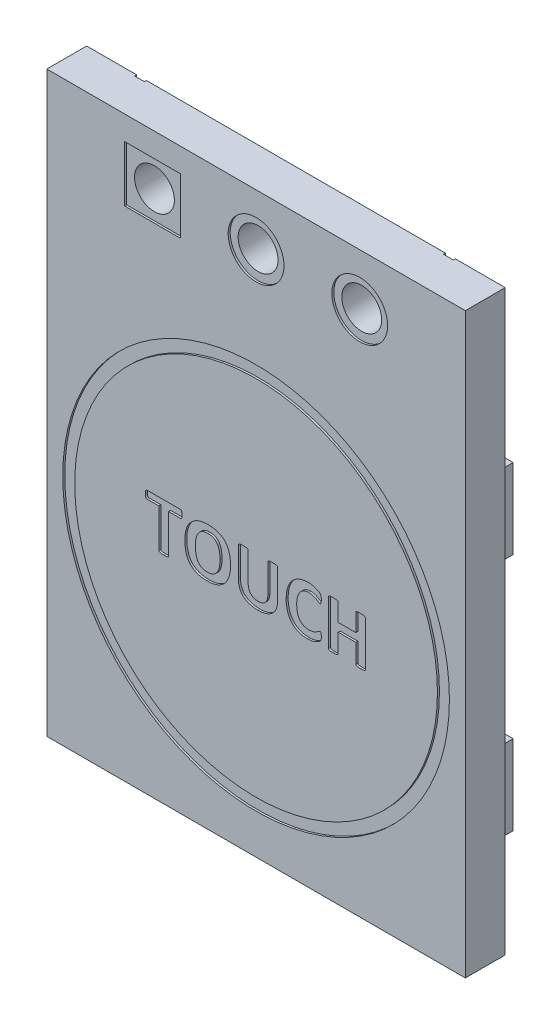
from build123d import *

# Parameters (mm, degrees)
SKETCH_1_W          = 10.5
SKETCH_1_H          = 14.5
SKETCH_1_R          = 0.5
EXTRUDE_1_DEPTH     = 1
SKETCH_2_R          = 4.85
SKETCH_2_R_2        = 4.55
CUT_EXTRUDE_1_DEPTH = 0.05
SKETCH_3_W          = 1.3
SKETCH_3_H          = 2
SKETCH_3_W_2        = 3
EXTRUDE_2_DEPTH     = 1
SKETCH_4_R          = 0.7
SKETCH_4_W          = 1.4
SKETCH_4_H          = 1.4
CUT_EXTRUDE_2_DEPTH = 0.05
CUT_EXTRUDE_3_DEPTH = 0.05
CUT_EXTRUDE_START   = -0.05
SKETCH_6_R          = 0.7
SKETCH_6_W          = 1.4
SKETCH_6_H          = 1.4
CUT_EXTRUDE_4_DEPTH = 0.05


with BuildPart() as part:
    # Эскиз1 → Бобышка-Вытянуть1 (new body)
    with BuildSketch(Plane.XY):
        Rectangle(SKETCH_1_W, SKETCH_1_H)
        with Locations((0, 5.95)):
            Circle(SKETCH_1_R, mode=Mode.SUBTRACT)
        with Locations((2.6, 5.95)):
            Circle(SKETCH_1_R, mode=Mode.SUBTRACT)
        with Locations((-2.6, 5.95)):
            Circle(SKETCH_1_R, mode=Mode.SUBTRACT)
    extrude(amount=EXTRUDE_1_DEPTH)

    # Эскиз2 → Вырез-Вытянуть1 (cut)
    with BuildSketch(Plane.XY.offset(1)):
        with Locations((0, -1.4)):
            Circle(SKETCH_2_R)
        with Locations((0, -1.4)):
            Circle(SKETCH_2_R_2, mode=Mode.SUBTRACT)
    extrude(amount=-CUT_EXTRUDE_1_DEPTH, mode=Mode.SUBTRACT)

    # Эскиз3 → Бобышка-Вытянуть2 (add)
    with BuildSketch(Plane(origin=(0, 0, 0), x_dir=(-1, 0, 0), z_dir=(0, 0, -1))):
        with Locations((3.6, 2.05)):
            Rectangle(SKETCH_3_W, SKETCH_3_H)
        with Locations((0, -4.75)):
            Rectangle(SKETCH_3_W_2, SKETCH_3_H)
        with Locations((-3.8, -4.45)):
            Rectangle(SKETCH_3_W, SKETCH_3_H)
        with Locations((-3.8, 1.55)):
            Rectangle(SKETCH_3_W, SKETCH_3_H)
    extrude(amount=EXTRUDE_2_DEPTH)

    # Эскиз4 → Вырез-Вытянуть2 (cut)
    with BuildSketch(Plane(origin=(0, 0, 0), x_dir=(-1, 0, 0), z_dir=(0, 0, -1))):
        with Locations((0, 5.95)):
            Circle(SKETCH_4_R)
        with Locations((-2.6, 5.95)):
            Circle(SKETCH_4_R)
        with Locations((2.6, 5.95)):
            Rectangle(SKETCH_4_W, SKETCH_4_H)
    extrude(amount=-CUT_EXTRUDE_2_DEPTH, mode=Mode.SUBTRACT)

    # Эскиз5 → Вырез-Вытянуть3 (cut)
    # profile 1 of 10: a face of its own
    with BuildSketch(Plane(origin=(0, 0, 0), x_dir=(-1, 0, 0), z_dir=(0, 0, -1))):
        Polygon((4, 7.25), (4, 4.4), (-4, 4.4), (-4, 7.25), (-3.75, 7.25), (-3.75, 4.65), (3.75, 4.65), (3.75, 7.25), align=None)
    # profile 2 of 10: a face of its own
    with BuildSketch(Plane(origin=(0, 0, 0), x_dir=(-1, 0, 0), z_dir=(0, 0, -1))):
        with BuildLine():
            add(Edge.make_bspline(
                [(2.34765625, 3.238796752), (2.340609981, 3.238888212), (2.327497119, 3.239058417), (2.309407513, 3.240177654), (2.294637773, 3.242858015), (2.28293433, 3.245530114), (2.274316977, 3.249357027), (2.268458077, 3.254176612), (2.265139129, 3.260126788), (2.264852002, 3.264416842), (2.264705882, 3.26660006)],
                knots=[0, 0, 0, 0, 1.779398799, 3.31139939, 4.567095847, 5.566076679, 6.335911413, 6.925285077, 7.453074891, 8, 8, 8, 8], degree=3))
            add(Edge.make_bspline(
                [(2.264705882, 3.26660006), (2.264948198, 3.26852939), (2.265514373, 3.273037296), (2.268314236, 3.280439421), (2.272703986, 3.289304295), (2.278874068, 3.29961539), (2.285987669, 3.311664127), (2.29360845, 3.325599609), (2.301049849, 3.341608907), (2.309170404, 3.359201523), (2.317248482, 3.378681662), (2.324696869, 3.400070578), (2.332070305, 3.423127472), (2.33929764, 3.447946011), (2.345611347, 3.474723543), (2.349909942, 3.503692059), (2.35238392, 3.534632222), (2.352752072, 3.555964315), (2.352941176, 3.566921752)],
                knots=[0, 0, 0, 0, 0.293689548, 0.686209937, 1.189443138, 1.792310494, 2.504556712, 3.309067764, 4.196300198, 5.177446892, 6.24376757, 7.388474631, 8.606423563, 9.90981592, 11.302690418, 12.769350193, 14.340545492, 16, 16, 16, 16], degree=3))
            add(Edge.make_bspline(
                [(2.352941176, 3.566921752), (2.352623551, 3.578807494), (2.352002227, 3.602057788), (2.347396648, 3.636036763), (2.339486808, 3.668176795), (2.328838868, 3.698622254), (2.314740817, 3.726866065), (2.298970627, 3.753625724), (2.279437732, 3.777467268), (2.258164931, 3.799744299), (2.234148968, 3.819506148), (2.207806888, 3.836842702), (2.179085013, 3.851530751), (2.148259406, 3.863953862), (2.115484561, 3.873741817), (2.080917419, 3.880976886), (2.044676921, 3.885067653), (2.019924178, 3.885590192), (2.007352941, 3.885855575)],
                knots=[0, 0, 0, 0, 1.077017183, 2.106807158, 3.10010998, 4.072726939, 5.022687989, 5.957205647, 6.880832328, 7.808623027, 8.745380842, 9.692598978, 10.661219764, 11.664057199, 12.700586205, 13.757006006, 14.860845036, 16, 16, 16, 16], degree=3))
            add(Edge.make_bspline(
                [(2.007352941, 3.885855575), (1.99362916, 3.885631449), (1.966950122, 3.885195747), (1.92815898, 3.880654985), (1.891831678, 3.8737253), (1.858098577, 3.863751693), (1.826919655, 3.851469303), (1.798573346, 3.836348232), (1.77251022, 3.819372754), (1.749298557, 3.799765954), (1.728753852, 3.778081104), (1.710831089, 3.754369016), (1.695626577, 3.728549577), (1.683284192, 3.700678065), (1.673588697, 3.671114434), (1.666776173, 3.640012711), (1.66250893, 3.607404856), (1.662016163, 3.58516437), (1.661764706, 3.573815134)],
                knots=[0, 0, 0, 0, 1.248536176, 2.427154956, 3.549596263, 4.610608544, 5.624209524, 6.594026153, 7.52982316, 8.450067412, 9.352474283, 10.243391269, 11.149640416, 12.073337161, 13.012451872, 13.976513907, 14.967422708, 16, 16, 16, 16], degree=3))
            add(Edge.make_bspline(
                [(1.661764706, 3.573815134), (1.662118, 3.562531809), (1.662826368, 3.539908294), (1.668556785, 3.506559906), (1.677288659, 3.474339865), (1.686601115, 3.454450877), (1.691176471, 3.444679104)],
                knots=[0, 0, 0, 0, 1.012831231, 2.030766797, 3.032484847, 4, 4, 4, 4], degree=3))
            Line((1.691176471, 3.444679104), (1.911764706, 3.444679104))
            Line((1.911764706, 3.444679104), (1.911764706, 3.635625796))
            add(Edge.make_bspline(
                [(1.911764706, 3.635625796), (1.911968843, 3.637902589), (1.912375222, 3.642435045), (1.916315103, 3.648458192), (1.922121984, 3.6536983), (1.93048443, 3.65803304), (1.941601729, 3.661380855), (1.955636943, 3.663800751), (1.972863477, 3.665046783), (1.98536881, 3.665189514), (1.9921875, 3.66526734)],
                knots=[0, 0, 0, 0, 0.580503562, 1.155619503, 1.797861758, 2.58345463, 3.556663884, 4.779377147, 6.243914818, 8, 8, 8, 8], degree=3))
            add(Edge.make_bspline(
                [(1.9921875, 3.66526734), (1.999164726, 3.66523725), (2.01191601, 3.665182258), (2.02930598, 3.663415091), (2.043496502, 3.661469989), (2.054616605, 3.657949887), (2.063134182, 3.653769965), (2.068976359, 3.648452621), (2.072919536, 3.642436388), (2.073325489, 3.637903038), (2.073529412, 3.635625796)],
                knots=[0, 0, 0, 0, 1.778883453, 3.251012578, 4.459076064, 5.423263628, 6.218804493, 6.855093136, 7.42487773, 8, 8, 8, 8], degree=3))
            Line((2.073529412, 3.635625796), (2.073529412, 3.293484252))
            add(Edge.make_bspline(
                [(2.073529412, 3.293484252), (2.073306111, 3.289555521), (2.072873284, 3.281940421), (2.069603815, 3.27115894), (2.064130958, 3.261703521), (2.056697893, 3.253498918), (2.047025639, 3.247063216), (2.035658069, 3.242263897), (2.022524689, 3.239173707), (2.013192666, 3.238926892), (2.008272059, 3.238796752)],
                knots=[0, 0, 0, 0, 0.982011517, 1.903443187, 2.787656502, 3.696447357, 4.647879199, 5.669480075, 6.771158773, 8, 8, 8, 8], degree=3))
            Line((2.008272059, 3.238796752), (1.608685662, 3.238796752))
            add(Edge.make_bspline(
                [(1.608685662, 3.238796752), (1.601383771, 3.23919853), (1.587499432, 3.239962499), (1.570688475, 3.244759797), (1.559422064, 3.251943248), (1.551839127, 3.259299745), (1.545456785, 3.268911483), (1.537947962, 3.285315616), (1.529365497, 3.309988449), (1.518646519, 3.343238306), (1.508862824, 3.380286124), (1.500285317, 3.419361031), (1.493749373, 3.459260218), (1.488894303, 3.499733901), (1.485772033, 3.540447664), (1.485453295, 3.567758749), (1.485294118, 3.581397854)],
                knots=[0, 0, 0, 0, 0.779410862, 1.482027598, 1.830954187, 2.194854883, 2.600373776, 3.053371266, 4.115461934, 5.383780219, 6.7785542, 8.199579033, 9.648428948, 11.088040423, 12.545772806, 14, 14, 14, 14], degree=3))
            add(Edge.make_bspline(
                [(1.485294118, 3.581397854), (1.485654264, 3.6008708), (1.4863568, 3.638856558), (1.492894026, 3.694222267), (1.503675766, 3.746427195), (1.518573939, 3.795543361), (1.537521461, 3.841353707), (1.560740317, 3.883454678), (1.587394504, 3.922152501), (1.618198485, 3.956966867), (1.652488516, 3.98824745), (1.690802605, 4.015131427), (1.732327005, 4.038497719), (1.77742776, 4.057742117), (1.825754609, 4.073302606), (1.877551963, 4.083791347), (1.932331215, 4.090759446), (1.969952746, 4.091406756), (1.989200368, 4.091737928)],
                knots=[0, 0, 0, 0, 1.148924805, 2.241200712, 3.284689811, 4.291389652, 5.266076721, 6.204815913, 7.123988216, 8.033606789, 8.94250619, 9.856874996, 10.789904395, 11.749707613, 12.74615509, 13.780794235, 14.864628056, 16, 16, 16, 16], degree=3))
            add(Edge.make_bspline(
                [(1.989200368, 4.091737928), (2.009133996, 4.091312619), (2.048053594, 4.090482219), (2.104845549, 4.083546636), (2.158354829, 4.071797025), (2.208720665, 4.055745958), (2.255668435, 4.035294359), (2.299054192, 4.010831545), (2.338997987, 3.982726666), (2.374822835, 3.950396598), (2.407062792, 3.914587384), (2.435134804, 3.875044388), (2.459400335, 3.832113875), (2.47935658, 3.785700641), (2.495171914, 3.736218533), (2.506695457, 3.683936668), (2.51338985, 3.628830371), (2.514260443, 3.591220149), (2.514705882, 3.571976899)],
                knots=[0, 0, 0, 0, 1.145759738, 2.237049263, 3.283057264, 4.291298139, 5.271383886, 6.221767555, 7.150355457, 8.07337199, 8.990170157, 9.915169836, 10.855719262, 11.820178955, 12.814495563, 13.838054106, 14.893841544, 16, 16, 16, 16], degree=3))
            add(Edge.make_bspline(
                [(2.514705882, 3.571976899), (2.514647342, 3.561404207), (2.514533156, 3.540781858), (2.51277753, 3.510518099), (2.510429797, 3.481673164), (2.506638982, 3.454339), (2.502307943, 3.428674871), (2.49743723, 3.404622364), (2.492256399, 3.38221661), (2.484825472, 3.355574584), (2.47504024, 3.32635892), (2.463556255, 3.300488112), (2.454243031, 3.283444603), (2.448010569, 3.273255762), (2.442360106, 3.264968937), (2.435219486, 3.256241169), (2.423398264, 3.248128818), (2.408877108, 3.243683537), (2.394686317, 3.24100956), (2.38114545, 3.239830756), (2.365211423, 3.238822477), (2.353786105, 3.238805734), (2.34765625, 3.238796752)],
                knots=[0, 0, 0, 0, 1.504834915, 2.935225369, 4.314286253, 5.623473051, 6.862107551, 8.018953422, 9.116525852, 10.134992674, 11.955575965, 13.49775021, 14.156484999, 14.719361055, 15.197250953, 15.583977948, 16.319132894, 17.194945814, 17.727432017, 18.374053831, 19.127655391, 20, 20, 20, 20], degree=3))
        make_face()
    # profile 3 of 10: a face of its own
    with BuildSketch(Plane(origin=(0, 0, 0), x_dir=(-1, 0, 0), z_dir=(0, 0, -1))):
        with BuildLine():
            add(Edge.make_bspline(
                [(1.572380515, 2.209384987), (1.566758643, 2.209689939), (1.555923306, 2.210277689), (1.540666261, 2.214877879), (1.527898922, 2.222671145), (1.517282486, 2.232489357), (1.509049047, 2.244469078), (1.503697686, 2.258263091), (1.500798284, 2.272990302), (1.500265938, 2.282979397), (1.5, 2.287969546)],
                knots=[0, 0, 0, 0, 1.119587883, 2.157841993, 3.137061224, 4.076806375, 5.021128735, 6.007699032, 7.004726924, 8, 8, 8, 8], degree=3))
            Line((1.5, 2.287969546), (1.5, 2.377123957))
            add(Edge.make_bspline(
                [(1.5, 2.377123957), (1.500238091, 2.385793266), (1.500681689, 2.401945455), (1.504630633, 2.424926476), (1.512891216, 2.445244801), (1.526041098, 2.463462268), (1.543611787, 2.480702826), (1.567006957, 2.496738484), (1.595852845, 2.513395972), (1.617562677, 2.523807306), (1.629365809, 2.529467707)],
                knots=[0, 0, 0, 0, 0.966324417, 1.800403729, 2.585389016, 3.388512048, 4.288246215, 5.316681711, 6.541142035, 8, 8, 8, 8], degree=3))
            Line((1.629365809, 2.529467707), (2.106387868, 2.76269381))
            add(Edge.make_bspline(
                [(2.106387868, 2.76269381), (2.121050443, 2.769682815), (2.151320959, 2.784111438), (2.198280761, 2.804230351), (2.245982857, 2.824149846), (2.278294246, 2.835956179), (2.294117647, 2.841737928)],
                knots=[0, 0, 0, 0, 0.95641289, 1.974490259, 3.00807566, 4, 4, 4, 4], degree=3))
            Line((2.294117647, 2.841737928), (2.294117647, 2.843346384))
            add(Edge.make_bspline(
                [(2.294117647, 2.843346384), (2.275276566, 2.842912884), (2.237674244, 2.842047721), (2.181066641, 2.841654427), (2.123697959, 2.8417597), (2.08509499, 2.841745262), (2.065487132, 2.841737928)],
                knots=[0, 0, 0, 0, 0.989090355, 1.973989423, 2.970915262, 4, 4, 4, 4], degree=3))
            Line((2.065487132, 2.841737928), (1.533777574, 2.841737928))
            add(Edge.make_bspline(
                [(1.533777574, 2.841737928), (1.531303609, 2.841991082), (1.526300865, 2.842502999), (1.518927784, 2.845789664), (1.513109541, 2.852662896), (1.508172555, 2.862271855), (1.504897691, 2.875467747), (1.501706752, 2.892304421), (1.500466456, 2.913799389), (1.50016647, 2.929668735), (1.5, 2.93847506)],
                knots=[0, 0, 0, 0, 0.532944552, 1.077697464, 1.68318278, 2.42657119, 3.384916904, 4.588823808, 6.107046925, 8, 8, 8, 8], degree=3))
            add(Edge.make_bspline(
                [(1.5, 2.93847506), (1.500149744, 2.947132044), (1.500420391, 2.962778713), (1.501852321, 2.983989395), (1.504518563, 3.000699691), (1.5080288, 3.013562571), (1.512711296, 3.022886132), (1.51869207, 3.029041839), (1.525633215, 3.032490235), (1.530602032, 3.032772943), (1.533088235, 3.032914399)],
                knots=[0, 0, 0, 0, 1.898594668, 3.43152817, 4.657506865, 5.603455172, 6.347416424, 6.917484938, 7.458351575, 8, 8, 8, 8], degree=3))
            Line((1.533088235, 3.032914399), (2.427619485, 3.032914399))
            add(Edge.make_bspline(
                [(2.427619485, 3.032914399), (2.433313222, 3.03267848), (2.444105593, 3.032231301), (2.459271335, 3.028109187), (2.472013493, 3.02081453), (2.482254236, 3.010863725), (2.490290384, 2.999200064), (2.495813869, 2.985947068), (2.499401643, 2.971599612), (2.499797128, 2.961551988), (2.5, 2.956397854)],
                knots=[0, 0, 0, 0, 1.147549194, 2.17515806, 3.137577991, 4.077772196, 5.033841095, 5.975558705, 6.961521558, 8, 8, 8, 8], degree=3))
            Line((2.5, 2.956397854), (2.5, 2.842886825))
            add(Edge.make_bspline(
                [(2.5, 2.842886825), (2.499871327, 2.833522599), (2.499633682, 2.81622793), (2.495654926, 2.792281803), (2.489296162, 2.771467414), (2.478759985, 2.753364484), (2.464535715, 2.736837459), (2.445839316, 2.721876288), (2.422749529, 2.707605009), (2.405418689, 2.699186434), (2.396139706, 2.694679104)],
                knots=[0, 0, 0, 0, 1.148439133, 2.121037438, 2.971705988, 3.805834735, 4.672982658, 5.635202017, 6.733880186, 8, 8, 8, 8], degree=3))
            Line((2.396139706, 2.694679104), (2.032398897, 2.51292359))
            add(Edge.make_bspline(
                [(2.032398897, 2.51292359), (2.02143996, 2.507651298), (1.999738534, 2.497210846), (1.9675238, 2.48143954), (1.935522028, 2.466238893), (1.903698204, 2.451610254), (1.87214961, 2.437439981), (1.841204628, 2.423233329), (1.810186702, 2.41001746), (1.789670077, 2.401109292), (1.779411765, 2.396655207)],
                knots=[0, 0, 0, 0, 1.048149469, 2.075597171, 3.091378283, 4.101566792, 5.094261913, 6.072207032, 7.036103516, 8, 8, 8, 8], degree=3))
            add(Edge.make_bspline(
                [(1.779411765, 2.396655207), (1.797639078, 2.396713998), (1.834851547, 2.398241361), (1.891081081, 2.399437717), (1.9471469, 2.40048168), (1.98422131, 2.400535309), (2.002297794, 2.400561457)],
                knots=[0, 0, 0, 0, 0.981864332, 2.004551901, 3.027073275, 4, 4, 4, 4], degree=3))
            Line((2.002297794, 2.400561457), (2.467141544, 2.400561457))
            add(Edge.make_bspline(
                [(2.467141544, 2.400561457), (2.469565813, 2.400357277), (2.474479851, 2.399943399), (2.481314415, 2.395782012), (2.487195764, 2.388890811), (2.492204699, 2.378924392), (2.495997129, 2.36554641), (2.49825142, 2.348388552), (2.49990307, 2.32691126), (2.499965409, 2.311028755), (2.5, 2.302215869)],
                knots=[0, 0, 0, 0, 0.513514522, 1.040903369, 1.654763982, 2.430140109, 3.402872071, 4.610164628, 6.119047709, 8, 8, 8, 8], degree=3))
            add(Edge.make_bspline(
                [(2.5, 2.302215869), (2.499957871, 2.293786684), (2.499880794, 2.278364819), (2.498262879, 2.257491988), (2.496042263, 2.240869292), (2.49231614, 2.228232857), (2.487070411, 2.219321946), (2.481285359, 2.213098985), (2.474248988, 2.209826438), (2.469392853, 2.209534264), (2.466911765, 2.209384987)],
                knots=[0, 0, 0, 0, 1.871394417, 3.423864974, 4.645973776, 5.592737433, 6.324952366, 6.926341917, 7.45144833, 8, 8, 8, 8], degree=3))
            Line((2.466911765, 2.209384987), (1.572380515, 2.209384987))
        make_face()
    # profile 4 of 10: a face of its own
    with BuildSketch(Plane(origin=(0, 0, 0), x_dir=(-1, 0, 0), z_dir=(0, 0, -1))):
        with BuildLine():
            add(Edge.make_bspline(
                [(2.014705882, 1.150561457), (1.992550139, 1.150961859), (1.949808765, 1.151734287), (1.888252917, 1.158761498), (1.831578278, 1.169786403), (1.779778454, 1.18558366), (1.732901023, 1.205962741), (1.690340641, 1.22988531), (1.652381432, 1.258025092), (1.619091397, 1.290339349), (1.589782807, 1.326142885), (1.565299551, 1.366055355), (1.54442441, 1.409267452), (1.527857165, 1.456453927), (1.515342337, 1.507735287), (1.506560531, 1.563459364), (1.500944626, 1.623715694), (1.500322113, 1.665483873), (1.5, 1.687096384)],
                knots=[0, 0, 0, 0, 1.243195588, 2.398289499, 3.472438518, 4.480099057, 5.431298172, 6.336213933, 7.214965272, 8.075406065, 8.934169752, 9.8050299, 10.69723392, 11.623227574, 12.606491238, 13.656063147, 14.787154231, 16, 16, 16, 16], degree=3))
            Line((1.5, 1.687096384), (1.5, 1.927905207))
            add(Edge.make_bspline(
                [(1.5, 1.927905207), (1.50016583, 1.932055844), (1.500486158, 1.940073501), (1.503278734, 1.951656552), (1.508221308, 1.962000372), (1.514691584, 1.971512439), (1.523557206, 1.979584887), (1.535159392, 1.98499196), (1.548922108, 1.988221739), (1.558803106, 1.988595871), (1.564108456, 1.988796752)],
                knots=[0, 0, 0, 0, 0.990179711, 1.912700015, 2.820789353, 3.713653051, 4.646088367, 5.643837726, 6.734918842, 8, 8, 8, 8], degree=3))
            Line((1.564108456, 1.988796752), (2.435891544, 1.988796752))
            add(Edge.make_bspline(
                [(2.435891544, 1.988796752), (2.441195266, 1.988591746), (2.451073234, 1.988209932), (2.46478839, 1.985045855), (2.476269535, 1.979524595), (2.48505467, 1.971445467), (2.491812673, 1.962077606), (2.49670682, 1.95164653), (2.499517789, 1.94007624), (2.499835517, 1.932056778), (2.5, 1.927905207)],
                knots=[0, 0, 0, 0, 1.265995626, 2.357865433, 3.339934658, 4.273043988, 5.177171631, 6.085917384, 7.009104535, 8, 8, 8, 8], degree=3))
            Line((2.5, 1.927905207), (2.5, 1.66917359))
            add(Edge.make_bspline(
                [(2.5, 1.66917359), (2.499724844, 1.647557075), (2.499194836, 1.605919092), (2.493000253, 1.546040344), (2.483738301, 1.491057972), (2.469849783, 1.441074623), (2.452262907, 1.395406927), (2.430907228, 1.353697425), (2.405734993, 1.315590574), (2.376543313, 1.281539595), (2.344093036, 1.25075864), (2.307293372, 1.224703245), (2.267471681, 1.201625808), (2.223698421, 1.183198667), (2.176594086, 1.168281314), (2.125717029, 1.158281458), (2.071410546, 1.151574276), (2.033952428, 1.150905225), (2.014705882, 1.150561457)],
                knots=[0, 0, 0, 0, 1.277119296, 2.460002067, 3.554068866, 4.56891834, 5.520573265, 6.44178675, 7.333232203, 8.213143003, 9.087504839, 9.969509283, 10.871842518, 11.802704797, 12.770587621, 13.787142021, 14.863000174, 16, 16, 16, 16], degree=3))
        make_face()
        with BuildLine():
            add(Edge.make_bspline(
                [(2.006893382, 1.35644381), (2.018466177, 1.356676154), (2.04127373, 1.357134054), (2.074824502, 1.36040147), (2.107132965, 1.365712228), (2.138195666, 1.372867807), (2.16755301, 1.382787535), (2.195198379, 1.394860521), (2.220493584, 1.409971113), (2.243984592, 1.427261236), (2.265253667, 1.447296801), (2.283940067, 1.470329771), (2.300323575, 1.495864086), (2.314052492, 1.524472361), (2.325296824, 1.556598695), (2.332826938, 1.593128803), (2.337386667, 1.634130931), (2.33794257, 1.662956288), (2.338235294, 1.678134987)],
                knots=[0, 0, 0, 0, 1.049626046, 2.068592971, 3.054261278, 4.018143076, 4.956242261, 5.86126734, 6.748926599, 7.622914204, 8.502599006, 9.391263619, 10.306681874, 11.248170676, 12.263246045, 13.386056063, 14.623563693, 16, 16, 16, 16], degree=3))
            Line((2.338235294, 1.678134987), (2.338235294, 1.782914399))
            Line((2.338235294, 1.782914399), (1.661764706, 1.782914399))
            Line((1.661764706, 1.782914399), (1.661764706, 1.674918075))
            add(Edge.make_bspline(
                [(1.661764706, 1.674918075), (1.662030887, 1.661275176), (1.662543489, 1.635002236), (1.666386593, 1.59725102), (1.672922256, 1.562826313), (1.682341693, 1.531672635), (1.694658872, 1.503463186), (1.709718668, 1.477859592), (1.727167473, 1.454298196), (1.747919856, 1.433670653), (1.770903931, 1.414987229), (1.797051684, 1.399551293), (1.825332846, 1.385709211), (1.856609576, 1.375179198), (1.890376649, 1.366515536), (1.926854262, 1.360833825), (1.965985623, 1.356960487), (1.992942983, 1.356620008), (2.006893382, 1.35644381)],
                knots=[0, 0, 0, 0, 1.212284114, 2.334567395, 3.367799545, 4.321639246, 5.220796268, 6.096353087, 6.956723451, 7.818277712, 8.689963065, 9.5818251, 10.510387323, 11.483391085, 12.508587825, 13.605230326, 14.760709728, 16, 16, 16, 16], degree=3))
        make_face(mode=Mode.SUBTRACT)
    # profile 5 of 10: a face of its own
    with BuildSketch(Plane(origin=(0, 0, 0), x_dir=(-1, 0, 0), z_dir=(0, 0, -1))):
        with BuildLine():
            add(Edge.make_bspline(
                [(-0.467830882, 3.841737928), (-0.470241518, 3.842053305), (-0.475180796, 3.842699496), (-0.482271785, 3.846594168), (-0.487905571, 3.853976771), (-0.492491042, 3.864401612), (-0.495214484, 3.878511456), (-0.498252913, 3.896312045), (-0.499542142, 3.918853407), (-0.499837072, 3.935489061), (-0.5, 3.944679104)],
                knots=[0, 0, 0, 0, 0.498707244, 1.021827348, 1.616370009, 2.379739004, 3.352847354, 4.568078665, 6.104101783, 8, 8, 8, 8], degree=3))
            add(Edge.make_bspline(
                [(-0.5, 3.944679104), (-0.499839081, 3.953716885), (-0.499545581, 3.970200941), (-0.498205361, 3.992730319), (-0.4952636, 4.010705641), (-0.492481128, 4.024942612), (-0.487923497, 4.035416619), (-0.482201103, 4.042699194), (-0.475271681, 4.046992431), (-0.470254173, 4.047415805), (-0.467830882, 4.047620281)],
                knots=[0, 0, 0, 0, 1.863228801, 3.398353026, 4.644066529, 5.616605408, 6.379527673, 6.973722403, 7.504341763, 8, 8, 8, 8], degree=3))
            Line((-0.467830882, 4.047620281), (0.467830882, 4.047620281))
            add(Edge.make_bspline(
                [(0.467830882, 4.047620281), (0.470340081, 4.047439599), (0.47538702, 4.047076179), (0.482287059, 4.042595474), (0.487957555, 4.035210824), (0.49207086, 4.024443504), (0.495400615, 4.010380844), (0.498085896, 3.992476081), (0.499947445, 3.970146098), (0.499981339, 3.95372194), (0.5, 3.944679104)],
                knots=[0, 0, 0, 0, 0.51152551, 1.028869507, 1.635637596, 2.407100011, 3.38387667, 4.614658833, 6.136094318, 8, 8, 8, 8], degree=3))
            add(Edge.make_bspline(
                [(0.5, 3.944679104), (0.499978791, 3.935483844), (0.499940383, 3.918831546), (0.498130205, 3.896338667), (0.495363446, 3.878450709), (0.492117503, 3.864509401), (0.487958255, 3.85391228), (0.482282621, 3.846687837), (0.475300152, 3.84260897), (0.470328531, 3.842029196), (0.467830882, 3.841737928)],
                knots=[0, 0, 0, 0, 1.895582807, 3.432834476, 4.648074481, 5.624899837, 6.381875126, 6.976422041, 7.485773875, 8, 8, 8, 8], degree=3))
            Line((0.467830882, 3.841737928), (-0.467830882, 3.841737928))
        make_face()
    # profile 6 of 10: a face of its own
    with BuildSketch(Plane(origin=(0, 0, 0), x_dir=(-1, 0, 0), z_dir=(0, 0, -1))):
        with BuildLine():
            add(Edge.make_bspline(
                [(-0.701286765, 3.532914399), (-0.70440838, 3.53433037), (-0.710266532, 3.536987641), (-0.718063896, 3.542756609), (-0.723663294, 3.550977952), (-0.728317453, 3.561195726), (-0.731210439, 3.574181087), (-0.733929401, 3.589948684), (-0.735052579, 3.60949446), (-0.735208388, 3.623831198), (-0.735294118, 3.631719546)],
                knots=[0, 0, 0, 0, 0.737752819, 1.384497422, 2.057633702, 2.854953043, 3.791201774, 4.911274809, 6.30052429, 8, 8, 8, 8], degree=3))
            add(Edge.make_bspline(
                [(-0.735294118, 3.631719546), (-0.73521255, 3.641452465), (-0.735065814, 3.658961414), (-0.732926246, 3.682513446), (-0.729231657, 3.700834948), (-0.724011834, 3.714424741), (-0.716713467, 3.723841472), (-0.70675888, 3.727857257), (-0.695700643, 3.727447731), (-0.6882992, 3.725271642), (-0.684283088, 3.724090869)],
                knots=[0, 0, 0, 0, 1.816358663, 3.267522501, 4.408951004, 5.293236442, 5.972506597, 6.562030223, 7.219740436, 8, 8, 8, 8], degree=3))
            Line((-0.684283088, 3.724090869), (0.612362132, 3.253502634))
            add(Edge.make_bspline(
                [(0.612362132, 3.253502634), (0.615508041, 3.25235869), (0.621549226, 3.250161938), (0.629216456, 3.244266221), (0.635575009, 3.236622266), (0.639701331, 3.226169892), (0.64325898, 3.213257746), (0.645193696, 3.197015343), (0.646969823, 3.177331959), (0.647027441, 3.162976144), (0.647058824, 3.155157046)],
                knots=[0, 0, 0, 0, 0.714359537, 1.371806707, 2.049487737, 2.822162994, 3.759169376, 4.921382755, 6.323187471, 8, 8, 8, 8], degree=3))
            add(Edge.make_bspline(
                [(0.647058824, 3.155157046), (0.647029801, 3.145189339), (0.646978104, 3.12743377), (0.644357254, 3.103859501), (0.64101819, 3.08572992), (0.635801079, 3.072371717), (0.628343568, 3.063329227), (0.618588862, 3.058918074), (0.607509153, 3.059548041), (0.600069586, 3.06135132), (0.596047794, 3.062326163)],
                knots=[0, 0, 0, 0, 1.861834867, 3.316503668, 4.428524347, 5.300865138, 5.970298383, 6.566346717, 7.224974473, 8, 8, 8, 8], degree=3))
            Line((0.596047794, 3.062326163), (-0.701286765, 3.532914399))
        make_face()
    # profile 7 of 10: a face of its own
    with BuildSketch(Plane(origin=(0, 0, 0), x_dir=(-1, 0, 0), z_dir=(0, 0, -1))):
        with BuildLine():
            add(Edge.make_bspline(
                [(0.011488971, 2.032914399), (-0.008590408, 2.033338668), (-0.047761288, 2.034166334), (-0.104879772, 2.039805762), (-0.158693836, 2.049813814), (-0.209297781, 2.063137088), (-0.256442772, 2.080602245), (-0.299850733, 2.102053684), (-0.339717051, 2.127164591), (-0.37572769, 2.156240985), (-0.407891695, 2.189086577), (-0.436048215, 2.225561118), (-0.460127644, 2.265757697), (-0.480157835, 2.309574972), (-0.495788479, 2.357122027), (-0.50666105, 2.408278756), (-0.513432347, 2.46288011), (-0.514273699, 2.500495025), (-0.514705882, 2.519816972)],
                knots=[0, 0, 0, 0, 1.181233459, 2.304351873, 3.371947617, 4.39826701, 5.3791809, 6.324264344, 7.241792078, 8.145350426, 9.040703723, 9.940163258, 10.849690114, 11.791286947, 12.768758951, 13.787772497, 14.863627853, 16, 16, 16, 16], degree=3))
            add(Edge.make_bspline(
                [(-0.514705882, 2.519816972), (-0.51440012, 2.538828713), (-0.513806817, 2.575719292), (-0.507891634, 2.629181556), (-0.498721678, 2.678988252), (-0.485380178, 2.725045593), (-0.468156662, 2.767397046), (-0.446921294, 2.806065168), (-0.421740383, 2.841150856), (-0.392201171, 2.872383734), (-0.35875127, 2.90019929), (-0.32080992, 2.923844824), (-0.27900194, 2.944275794), (-0.23263957, 2.960372087), (-0.182218919, 2.973230584), (-0.127412736, 2.98228377), (-0.068282974, 2.987832368), (-0.027356608, 2.988468151), (-0.006204044, 2.988796752)],
                knots=[0, 0, 0, 0, 1.146166388, 2.224033198, 3.239603498, 4.19707874, 5.110637026, 5.991361923, 6.851607032, 7.707774656, 8.577185544, 9.467848022, 10.397508704, 11.377842912, 12.422004822, 13.532246611, 14.72455543, 16, 16, 16, 16], degree=3))
            add(Edge.make_bspline(
                [(-0.006204044, 2.988796752), (0.013421814, 2.988507127), (0.051774095, 2.987941151), (0.107664048, 2.981688191), (0.16061625, 2.972315421), (0.210315766, 2.958409505), (0.256965503, 2.941078764), (0.300052516, 2.919720461), (0.339530365, 2.894476464), (0.375291382, 2.865406621), (0.407429946, 2.832625614), (0.435656502, 2.79611492), (0.459620865, 2.755766982), (0.479610087, 2.711929078), (0.495640419, 2.664475295), (0.506683124, 2.613297498), (0.513442593, 2.558447881), (0.51427609, 2.520679882), (0.514705882, 2.50120484)],
                knots=[0, 0, 0, 0, 1.160742572, 2.268289337, 3.323413741, 4.339376884, 5.317477958, 6.263969784, 7.179163288, 8.084428609, 8.984962506, 9.889626401, 10.808302956, 11.755347959, 12.735609472, 13.765915531, 14.84799589, 16, 16, 16, 16], degree=3))
            add(Edge.make_bspline(
                [(0.514705882, 2.50120484), (0.514402086, 2.482575695), (0.513812934, 2.446448275), (0.507854944, 2.39390625), (0.498638556, 2.3447549), (0.485593936, 2.298901857), (0.468549725, 2.2565857), (0.447649238, 2.217657626), (0.422414377, 2.182423464), (0.393000865, 2.150985237), (0.359547294, 2.123173016), (0.322113949, 2.099010324), (0.280579134, 2.078415124), (0.234845299, 2.061776558), (0.185012932, 2.048642597), (0.130920647, 2.039760767), (0.072667317, 2.033786185), (0.032338545, 2.033211503), (0.011488971, 2.032914399)],
                knots=[0, 0, 0, 0, 1.132297744, 2.19586009, 3.210614101, 4.17017675, 5.089475104, 5.97928108, 6.850365169, 7.716955887, 8.58991781, 9.488986787, 10.419971928, 11.402760547, 12.443138575, 13.548716153, 14.732710582, 16, 16, 16, 16], degree=3))
        make_face()
        with BuildLine():
            add(Edge.make_bspline(
                [(0.000459559, 2.253502634), (0.013406898, 2.253614304), (0.038710508, 2.253832547), (0.075753887, 2.256136517), (0.110925841, 2.26011606), (0.144311584, 2.265131364), (0.175649717, 2.272530415), (0.204799975, 2.281745262), (0.231521135, 2.293426432), (0.256025611, 2.306853264), (0.278091947, 2.32283201), (0.297602026, 2.341294105), (0.314156042, 2.362478011), (0.328458006, 2.385857932), (0.339517924, 2.412269118), (0.347529979, 2.441518323), (0.352046738, 2.473874582), (0.352634536, 2.496365316), (0.352941176, 2.508098222)],
                knots=[0, 0, 0, 0, 1.248284162, 2.439581939, 3.57646079, 4.660692936, 5.692499406, 6.678075816, 7.604166823, 8.500084251, 9.367200805, 10.223876271, 11.080838181, 11.952221325, 12.858909996, 13.831787445, 14.868892633, 16, 16, 16, 16], degree=3))
            add(Edge.make_bspline(
                [(0.352941176, 2.508098222), (0.352598343, 2.519990419), (0.351939939, 2.54282909), (0.34665879, 2.575595678), (0.337726548, 2.605297256), (0.325209617, 2.632018384), (0.309532282, 2.655765171), (0.291858787, 2.677403318), (0.271391085, 2.696301896), (0.248765568, 2.712878024), (0.223978108, 2.727251394), (0.197036051, 2.739086341), (0.168129332, 2.748827391), (0.137374989, 2.755942277), (0.105286138, 2.761419368), (0.072140744, 2.765200641), (0.03811296, 2.767953204), (0.015094599, 2.768122731), (0.003446691, 2.768208516)],
                knots=[0, 0, 0, 0, 1.153283464, 2.214852352, 3.209144116, 4.15318738, 5.066220202, 5.963392081, 6.857172692, 7.760783466, 8.679693563, 9.631077684, 10.61093758, 11.634642483, 12.690108401, 13.767552338, 14.870321563, 16, 16, 16, 16], degree=3))
            add(Edge.make_bspline(
                [(0.003446691, 2.768208516), (-0.009960487, 2.768099363), (-0.036106515, 2.767886497), (-0.074216794, 2.765566784), (-0.110264213, 2.761695277), (-0.144176843, 2.756223115), (-0.175969799, 2.749285869), (-0.205468669, 2.740088849), (-0.232495597, 2.728583485), (-0.257344299, 2.715377713), (-0.279530719, 2.699572049), (-0.298899977, 2.681176404), (-0.315365911, 2.660111955), (-0.329403632, 2.636797736), (-0.33998423, 2.610326519), (-0.347461337, 2.580898266), (-0.352071692, 2.548300212), (-0.352643188, 2.525500898), (-0.352941176, 2.513612928)],
                knots=[0, 0, 0, 0, 1.279679538, 2.49556889, 3.642896623, 4.739116128, 5.77323068, 6.746743089, 7.683741469, 8.573599826, 9.427780593, 10.275900703, 11.114034936, 11.972958761, 12.864977117, 13.824357256, 14.865580979, 16, 16, 16, 16], degree=3))
            add(Edge.make_bspline(
                [(-0.352941176, 2.513612928), (-0.352606972, 2.501718454), (-0.351965139, 2.478875411), (-0.346561285, 2.446088134), (-0.338009292, 2.416266133), (-0.325686024, 2.389418989), (-0.310048117, 2.365744325), (-0.292234159, 2.344222659), (-0.271610387, 2.325408792), (-0.248715682, 2.308778705), (-0.223612384, 2.294458441), (-0.196182106, 2.282917669), (-0.167095514, 2.272841127), (-0.135915953, 2.265762839), (-0.103372928, 2.260271545), (-0.069611013, 2.256514637), (-0.034895327, 2.253757343), (-0.01141808, 2.253588205), (0.000459559, 2.253502634)],
                knots=[0, 0, 0, 0, 1.144038368, 2.197097374, 3.188363945, 4.121730304, 5.027443957, 5.911758703, 6.803781373, 7.706099283, 8.630428182, 9.57797775, 10.566307554, 11.588977022, 12.650515107, 13.741285723, 14.857268412, 16, 16, 16, 16], degree=3))
        make_face(mode=Mode.SUBTRACT)
    # profile 8 of 10: a face of its own
    with BuildSketch(Plane(origin=(0, 0, 0), x_dir=(-1, 0, 0), z_dir=(0, 0, -1))):
        with BuildLine():
            add(Edge.make_bspline(
                [(-2.460248162, 3.544403369), (-2.464193812, 3.545821409), (-2.471499275, 3.548446943), (-2.481631508, 3.554021133), (-2.48919402, 3.56310189), (-2.494446948, 3.575825214), (-2.497564362, 3.592825549), (-2.498847723, 3.610018775), (-2.49931148, 3.626587735), (-2.4998462, 3.641443222), (-2.500045932, 3.658143716), (-2.500015899, 3.669862952), (-2.5, 3.676066972)],
                knots=[0, 0, 0, 0, 0.844408057, 1.563441047, 2.295734498, 3.172174565, 4.305821613, 5.759988913, 6.639135718, 7.641529153, 8.751454454, 10, 10, 10, 10], degree=3))
            add(Edge.make_bspline(
                [(-2.5, 3.676066972), (-2.500014678, 3.685717729), (-2.500041822, 3.703564328), (-2.499870672, 3.728307845), (-2.499299869, 3.749083101), (-2.497968409, 3.76642569), (-2.495960177, 3.780547294), (-2.493492685, 3.792151276), (-2.490063198, 3.801438941), (-2.485836872, 3.809057308), (-2.480872994, 3.815251407), (-2.474280158, 3.819597863), (-2.466580221, 3.822915765), (-2.460952257, 3.824850946), (-2.457950368, 3.825883149)],
                knots=[0, 0, 0, 0, 2.065590314, 3.819779327, 5.296020431, 6.513125995, 7.540180458, 8.34747035, 9.047804135, 9.64969616, 10.208041169, 10.726451495, 11.320704417, 12, 12, 12, 12], degree=3))
            Line((-2.457950368, 3.825883149), (-1.579733456, 4.128502634))
            add(Edge.make_bspline(
                [(-1.579733456, 4.128502634), (-1.575370248, 4.129887675), (-1.567126649, 4.132504494), (-1.555550415, 4.136071448), (-1.545323239, 4.138361034), (-1.536512461, 4.139886073), (-1.528841891, 4.140248884), (-1.522073223, 4.139206025), (-1.516385073, 4.136301986), (-1.511569403, 4.131988939), (-1.507883272, 4.125997586), (-1.505192485, 4.118396366), (-1.503207915, 4.109203302), (-1.501896807, 4.098201025), (-1.501075624, 4.085236347), (-1.500305741, 4.06999406), (-1.500258019, 4.052444688), (-1.500089114, 4.039960601), (-1.5, 4.033373957)],
                knots=[0, 0, 0, 0, 1.276573251, 2.411885467, 3.37553279, 4.197132145, 4.902218777, 5.509658926, 6.082712836, 6.657356358, 7.291251154, 8.021129793, 8.896744583, 9.908644138, 11.107652844, 12.518634463, 14.163220425, 16, 16, 16, 16], degree=3))
            add(Edge.make_bspline(
                [(-1.5, 4.033373957), (-1.499949771, 4.027705256), (-1.4998554, 4.017054933), (-1.500472431, 4.002047578), (-1.500823171, 3.988942068), (-1.501681467, 3.974824021), (-1.503184358, 3.960545133), (-1.50605659, 3.946759663), (-1.51089151, 3.936616467), (-1.518293726, 3.930153515), (-1.527413771, 3.92618903), (-1.533917513, 3.923877318), (-1.537454044, 3.922620281)],
                knots=[0, 0, 0, 0, 1.326988102, 2.493137391, 3.515905883, 4.396232495, 5.804229884, 6.874172063, 7.684305974, 8.382744359, 9.120587064, 10, 10, 10, 10], degree=3))
            Line((-1.537454044, 3.922620281), (-2.301700368, 3.673309619))
            Line((-2.301700368, 3.673309619), (-1.541360294, 3.437326163))
            add(Edge.make_bspline(
                [(-1.541360294, 3.437326163), (-1.537345086, 3.436205293), (-1.530061736, 3.4341721), (-1.520197014, 3.429829063), (-1.512147647, 3.423028103), (-1.506801336, 3.412381368), (-1.502884164, 3.397987133), (-1.501753041, 3.383040466), (-1.500803341, 3.36840321), (-1.500475823, 3.35483418), (-1.499856856, 3.339291689), (-1.499950557, 3.328258396), (-1.5, 3.322436457)],
                knots=[0, 0, 0, 0, 0.926766729, 1.681100195, 2.38137408, 3.220216627, 4.282507745, 5.687709371, 6.540956644, 7.546558277, 8.705392344, 10, 10, 10, 10], degree=3))
            add(Edge.make_bspline(
                [(-1.5, 3.322436457), (-1.500100073, 3.31676972), (-1.500289403, 3.306048746), (-1.500200975, 3.290935061), (-1.501395479, 3.277860599), (-1.502039336, 3.26669723), (-1.503644894, 3.257368973), (-1.505891455, 3.249595553), (-1.508953794, 3.243237551), (-1.514684386, 3.237206016), (-1.524858627, 3.232778731), (-1.54013391, 3.233665907), (-1.559045763, 3.238700384), (-1.573099163, 3.243444622), (-1.581112132, 3.246149693)],
                knots=[0, 0, 0, 0, 1.30001791, 2.459520558, 3.463256689, 4.3093572, 5.022683592, 5.628399378, 6.162654668, 6.62240627, 7.510672863, 8.599777618, 10.061260599, 12, 12, 12, 12], degree=3))
            Line((-1.581112132, 3.246149693), (-2.460248162, 3.544403369))
        make_face()
    # profile 9 of 10: a face of its own
    with BuildSketch(Plane(origin=(0, 0, 0), x_dir=(-1, 0, 0), z_dir=(0, 0, -1))):
        with BuildLine():
            add(Edge.make_bspline(
                [(-2.333869485, 2.41526734), (-2.339692734, 2.415275461), (-2.350428913, 2.415290434), (-2.365297059, 2.416280171), (-2.377828731, 2.417524869), (-2.388387271, 2.419565926), (-2.397305077, 2.422381344), (-2.405490594, 2.425917471), (-2.413402678, 2.431672531), (-2.421204987, 2.437149608), (-2.428131284, 2.443881206), (-2.434354397, 2.451160418), (-2.441378318, 2.460306945), (-2.452354076, 2.475647646), (-2.465572307, 2.49909392), (-2.481212875, 2.531153381), (-2.494456556, 2.568711539), (-2.505868614, 2.610909515), (-2.513345642, 2.657735322), (-2.514242812, 2.690437771), (-2.514705882, 2.707316972)],
                knots=[0, 0, 0, 0, 0.817409155, 1.507037124, 2.091351391, 2.584885869, 3.013447773, 3.403287412, 3.829820449, 4.382603503, 4.740098075, 5.182209427, 5.726452742, 6.359048628, 7.829107965, 9.498266932, 11.362544405, 13.410328885, 15.631064777, 18, 18, 18, 18], degree=3))
            add(Edge.make_bspline(
                [(-2.514705882, 2.707316972), (-2.51428379, 2.7239531), (-2.513458407, 2.756484257), (-2.50773785, 2.804050931), (-2.497844181, 2.84905734), (-2.484076826, 2.891503351), (-2.466427296, 2.931306058), (-2.444472151, 2.967938644), (-2.418763502, 3.00158726), (-2.389180742, 3.03208536), (-2.355568022, 3.059401761), (-2.317963716, 3.083253798), (-2.276527802, 3.103801297), (-2.231229687, 3.120727402), (-2.182129231, 3.134346382), (-2.129129006, 3.1437955), (-2.072359692, 3.149648784), (-2.033256413, 3.150250997), (-2.013097426, 3.150561457)],
                knots=[0, 0, 0, 0, 1.048898634, 2.051071494, 3.015445474, 3.95012188, 4.860232668, 5.75474354, 6.636649859, 7.524644452, 8.427499351, 9.36128947, 10.326727027, 11.338523746, 12.405937675, 13.535086757, 14.729258665, 16, 16, 16, 16], degree=3))
            add(Edge.make_bspline(
                [(-2.013097426, 3.150561457), (-1.992474458, 3.150213678), (-1.952347655, 3.149536993), (-1.893969786, 3.142872155), (-1.839077216, 3.132587795), (-1.787938, 3.117496261), (-1.740439215, 3.098984507), (-1.696853295, 3.076822302), (-1.656918105, 3.051636046), (-1.621476625, 3.022415618), (-1.589771792, 2.990347736), (-1.561941612, 2.955231121), (-1.538435507, 2.916849093), (-1.519176891, 2.875566362), (-1.503910516, 2.831771324), (-1.493311096, 2.785609378), (-1.486285928, 2.737327094), (-1.485628887, 2.704355376), (-1.485294118, 2.687555943)],
                knots=[0, 0, 0, 0, 1.247488915, 2.427281123, 3.550805171, 4.622953559, 5.648903625, 6.631428415, 7.577722604, 8.499965247, 9.404545214, 10.302139903, 11.205174899, 12.121634227, 13.053885424, 14.00612014, 14.984097524, 16, 16, 16, 16], degree=3))
            add(Edge.make_bspline(
                [(-1.485294118, 2.687555943), (-1.485647524, 2.673904227), (-1.486343151, 2.647032908), (-1.491808578, 2.607757302), (-1.500064073, 2.57079251), (-1.510328989, 2.536523191), (-1.522476598, 2.505281147), (-1.534258191, 2.481771603), (-1.543901766, 2.465178927), (-1.550525946, 2.455016447), (-1.556725596, 2.446845891), (-1.563941046, 2.439142659), (-1.571614381, 2.432101988), (-1.580181598, 2.425907962), (-1.589248863, 2.422190574), (-1.599470457, 2.419625165), (-1.611682858, 2.417511086), (-1.626052829, 2.416288826), (-1.643214951, 2.415278616), (-1.655635064, 2.415271336), (-1.662454044, 2.41526734)],
                knots=[0, 0, 0, 0, 1.992374698, 3.921685737, 5.777330327, 7.517748816, 9.139460952, 10.664664016, 11.351231936, 11.940483538, 12.434765898, 12.846220727, 13.479550656, 13.954087228, 14.379878577, 14.90064456, 15.490744311, 16.187256458, 17.004754435, 18, 18, 18, 18], degree=3))
            add(Edge.make_bspline(
                [(-1.662454044, 2.41526734), (-1.669804055, 2.415410854), (-1.683361848, 2.41567558), (-1.70207052, 2.41617601), (-1.717335484, 2.418587593), (-1.729583537, 2.421429015), (-1.738527825, 2.426017702), (-1.745306694, 2.430778653), (-1.749318575, 2.437029696), (-1.749778278, 2.441570086), (-1.75, 2.443759987)],
                knots=[0, 0, 0, 0, 1.772474322, 3.269497114, 4.501713792, 5.495775834, 6.280023247, 6.911427383, 7.474964399, 8, 8, 8, 8], degree=3))
            add(Edge.make_bspline(
                [(-1.75, 2.443759987), (-1.749781355, 2.445847976), (-1.74930675, 2.450380312), (-1.746504192, 2.45732672), (-1.742291554, 2.46505125), (-1.733550337, 2.476818622), (-1.72073387, 2.494444933), (-1.704687508, 2.519822296), (-1.688692691, 2.550587757), (-1.6770055, 2.580104218), (-1.669145228, 2.606510591), (-1.66476547, 2.628804995), (-1.662316021, 2.652957112), (-1.661952631, 2.66970416), (-1.661764706, 2.678364766)],
                knots=[0, 0, 0, 0, 0.294650313, 0.63958879, 1.045377399, 1.533552277, 2.70187505, 4.118510006, 5.760118692, 7.582326316, 8.583252923, 9.639689707, 10.77938378, 12, 12, 12, 12], degree=3))
            add(Edge.make_bspline(
                [(-1.661764706, 2.678364766), (-1.66196364, 2.688039213), (-1.66235132, 2.706892672), (-1.667299096, 2.734281467), (-1.674362508, 2.760197379), (-1.685241208, 2.784306806), (-1.698552955, 2.80676588), (-1.714247239, 2.827758103), (-1.732889511, 2.846605096), (-1.75384177, 2.863960689), (-1.777393494, 2.879198302), (-1.802994816, 2.893026082), (-1.831257289, 2.904056439), (-1.861563653, 2.913547681), (-1.894106234, 2.920725163), (-1.928593572, 2.926432004), (-1.965181743, 2.929194981), (-1.990192759, 2.929709844), (-2.002987132, 2.929973222)],
                knots=[0, 0, 0, 0, 0.972328399, 1.894863164, 2.792722913, 3.669286515, 4.547069354, 5.416554998, 6.299601747, 7.208576243, 8.149255743, 9.11821745, 10.131627664, 11.197055664, 12.311544368, 13.482474146, 14.712160853, 16, 16, 16, 16], degree=3))
            add(Edge.make_bspline(
                [(-2.002987132, 2.929973222), (-2.016932177, 2.929740075), (-2.043865648, 2.929289774), (-2.082892815, 2.926201302), (-2.11896818, 2.920434891), (-2.15224295, 2.912666094), (-2.182682323, 2.902912969), (-2.210228902, 2.890815152), (-2.235147684, 2.877176591), (-2.257201024, 2.861428124), (-2.276470843, 2.843815783), (-2.293077378, 2.824406558), (-2.307265663, 2.803313887), (-2.318740332, 2.780537044), (-2.327539213, 2.756137913), (-2.333607157, 2.730221491), (-2.337738468, 2.702853496), (-2.338067498, 2.684048509), (-2.338235294, 2.674458516)],
                knots=[0, 0, 0, 0, 1.398194131, 2.700473162, 3.921342678, 5.05759551, 6.123717545, 7.121016656, 8.069798658, 8.966985046, 9.831226027, 10.680842586, 11.522158434, 12.373889462, 13.231416992, 14.116159322, 15.039296374, 16, 16, 16, 16], degree=3))
            add(Edge.make_bspline(
                [(-2.338235294, 2.674458516), (-2.338052492, 2.665797355), (-2.337700614, 2.649125414), (-2.335191556, 2.624981314), (-2.330874817, 2.602680016), (-2.323042633, 2.576115933), (-2.310791436, 2.546838288), (-2.294902697, 2.516158031), (-2.278775712, 2.4909537), (-2.266531195, 2.472954094), (-2.257763974, 2.461188634), (-2.253565067, 2.453706789), (-2.250737222, 2.447245875), (-2.25022779, 2.443090477), (-2.25, 2.441232413)],
                knots=[0, 0, 0, 0, 1.227441035, 2.362711601, 3.435706244, 4.442229318, 6.2827107, 7.923868668, 9.333455832, 10.519839527, 11.010743931, 11.409305314, 11.735874018, 12, 12, 12, 12], degree=3))
            add(Edge.make_bspline(
                [(-2.25, 2.441232413), (-2.250083166, 2.438917676), (-2.250235512, 2.434677431), (-2.252657113, 2.428625053), (-2.25808422, 2.42424922), (-2.265877301, 2.420563842), (-2.277131082, 2.418442934), (-2.291882937, 2.416143712), (-2.31127908, 2.415662702), (-2.325754498, 2.415409363), (-2.333869485, 2.41526734)],
                knots=[0, 0, 0, 0, 0.574503116, 1.052401729, 1.565121105, 2.263951184, 3.183740599, 4.396397545, 5.979803554, 8, 8, 8, 8], degree=3))
        make_face()
    # profile 10 of 10: a face of its own
    with BuildSketch(Plane(origin=(0, 0, 0), x_dir=(-1, 0, 0), z_dir=(0, 0, -1))):
        with BuildLine():
            add(Edge.make_bspline(
                [(-1.988511029, 1.35644381), (-2.008590408, 1.35686808), (-2.047761288, 1.357695745), (-2.104879772, 1.363335173), (-2.158693836, 1.373343226), (-2.209297781, 1.3866665), (-2.256442772, 1.404131657), (-2.299850733, 1.425583095), (-2.339717051, 1.450694003), (-2.37572769, 1.479770397), (-2.407891695, 1.512615989), (-2.436048215, 1.549090529), (-2.460127644, 1.589287109), (-2.480157835, 1.633104384), (-2.495788479, 1.680651439), (-2.50666105, 1.731808168), (-2.513432347, 1.786409522), (-2.514273699, 1.824024437), (-2.514705882, 1.843346384)],
                knots=[0, 0, 0, 0, 1.181233459, 2.304351873, 3.371947617, 4.39826701, 5.3791809, 6.324264344, 7.241792078, 8.145350426, 9.040703723, 9.940163258, 10.849690114, 11.791286947, 12.768758951, 13.787772497, 14.863627853, 16, 16, 16, 16], degree=3))
            add(Edge.make_bspline(
                [(-2.514705882, 1.843346384), (-2.51440012, 1.862358124), (-2.513806817, 1.899248703), (-2.507891634, 1.952710968), (-2.498721678, 2.002517663), (-2.485380178, 2.048575005), (-2.468156662, 2.090926458), (-2.446921294, 2.12959458), (-2.421740383, 2.164680268), (-2.392201171, 2.195913146), (-2.35875127, 2.223728701), (-2.32080992, 2.247374235), (-2.27900194, 2.267805205), (-2.23263957, 2.283901499), (-2.182218919, 2.296759996), (-2.127412736, 2.305813182), (-2.068282974, 2.31136178), (-2.027356608, 2.311997563), (-2.006204044, 2.312326163)],
                knots=[0, 0, 0, 0, 1.146166388, 2.224033198, 3.239603498, 4.19707874, 5.110637026, 5.991361923, 6.851607032, 7.707774656, 8.577185544, 9.467848022, 10.397508704, 11.377842912, 12.422004822, 13.532246611, 14.72455543, 16, 16, 16, 16], degree=3))
            add(Edge.make_bspline(
                [(-2.006204044, 2.312326163), (-1.986578186, 2.312036539), (-1.948225905, 2.311470562), (-1.892335952, 2.305217602), (-1.83938375, 2.295844833), (-1.789684234, 2.281938916), (-1.743034497, 2.264608175), (-1.699947484, 2.243249873), (-1.660469635, 2.218005876), (-1.624708618, 2.188936032), (-1.592570054, 2.156155026), (-1.564343498, 2.119644331), (-1.540379135, 2.079296394), (-1.520389913, 2.03545849), (-1.504359581, 1.988004707), (-1.493316876, 1.93682691), (-1.486557407, 1.881977293), (-1.48572391, 1.844209294), (-1.485294118, 1.824734252)],
                knots=[0, 0, 0, 0, 1.160742572, 2.268289337, 3.323413741, 4.339376884, 5.317477958, 6.263969784, 7.179163288, 8.084428609, 8.984962506, 9.889626401, 10.808302956, 11.755347959, 12.735609472, 13.765915531, 14.84799589, 16, 16, 16, 16], degree=3))
            add(Edge.make_bspline(
                [(-1.485294118, 1.824734252), (-1.485597914, 1.806105107), (-1.486187066, 1.769977687), (-1.492145056, 1.717435662), (-1.501361444, 1.668284312), (-1.514406064, 1.622431269), (-1.531450275, 1.580115112), (-1.552350762, 1.541187038), (-1.577585623, 1.505952876), (-1.606999135, 1.474514648), (-1.640452706, 1.446702428), (-1.677886051, 1.422539736), (-1.719420866, 1.401944536), (-1.765154701, 1.38530597), (-1.814987068, 1.372172009), (-1.869079353, 1.363290179), (-1.927332683, 1.357315596), (-1.967661455, 1.356740915), (-1.988511029, 1.35644381)],
                knots=[0, 0, 0, 0, 1.132297744, 2.19586009, 3.210614101, 4.17017675, 5.089475104, 5.97928108, 6.850365169, 7.716955887, 8.58991781, 9.488986787, 10.419971928, 11.402760547, 12.443138575, 13.548716153, 14.732710582, 16, 16, 16, 16], degree=3))
        make_face()
        with BuildLine():
            add(Edge.make_bspline(
                [(-1.999540441, 1.577032046), (-1.986593102, 1.577143716), (-1.961289492, 1.577361958), (-1.924246113, 1.579665929), (-1.889074159, 1.583645471), (-1.855688416, 1.588660776), (-1.824350283, 1.596059827), (-1.795200025, 1.605274674), (-1.768478865, 1.616955844), (-1.743974389, 1.630382676), (-1.721908053, 1.646361421), (-1.702397974, 1.664823517), (-1.685843958, 1.686007423), (-1.671541994, 1.709387344), (-1.660482076, 1.73579853), (-1.652470021, 1.765047735), (-1.647953262, 1.797403994), (-1.647365464, 1.819894728), (-1.647058824, 1.831627634)],
                knots=[0, 0, 0, 0, 1.248284162, 2.439581939, 3.57646079, 4.660692936, 5.692499406, 6.678075816, 7.604166823, 8.500084251, 9.367200805, 10.223876271, 11.080838181, 11.952221325, 12.858909996, 13.831787445, 14.868892633, 16, 16, 16, 16], degree=3))
            add(Edge.make_bspline(
                [(-1.647058824, 1.831627634), (-1.647401657, 1.843519831), (-1.648060061, 1.866358502), (-1.65334121, 1.89912509), (-1.662273452, 1.928826668), (-1.674790383, 1.955547796), (-1.690467718, 1.979294583), (-1.708141213, 2.00093273), (-1.728608915, 2.019831308), (-1.751234432, 2.036407436), (-1.776021892, 2.050780806), (-1.802963949, 2.062615753), (-1.831870668, 2.072356803), (-1.862625011, 2.079471689), (-1.894713862, 2.084948779), (-1.927859256, 2.088730053), (-1.96188704, 2.091482616), (-1.984905401, 2.091652143), (-1.996553309, 2.091737928)],
                knots=[0, 0, 0, 0, 1.153283464, 2.214852352, 3.209144116, 4.15318738, 5.066220202, 5.963392081, 6.857172692, 7.760783466, 8.679693563, 9.631077684, 10.61093758, 11.634642483, 12.690108401, 13.767552338, 14.870321563, 16, 16, 16, 16], degree=3))
            add(Edge.make_bspline(
                [(-1.996553309, 2.091737928), (-2.009960487, 2.091628775), (-2.036106515, 2.091415909), (-2.074216794, 2.089096196), (-2.110264213, 2.085224689), (-2.144176843, 2.079752527), (-2.175969799, 2.07281528), (-2.205468669, 2.06361826), (-2.232495597, 2.052112897), (-2.257344299, 2.038907124), (-2.279530719, 2.023101461), (-2.298899977, 2.004705816), (-2.315365911, 1.983641367), (-2.329403632, 1.960327148), (-2.33998423, 1.93385593), (-2.347461337, 1.904427677), (-2.352071692, 1.871829623), (-2.352643188, 1.84903031), (-2.352941176, 1.83714234)],
                knots=[0, 0, 0, 0, 1.279679538, 2.49556889, 3.642896623, 4.739116128, 5.77323068, 6.746743089, 7.683741469, 8.573599826, 9.427780593, 10.275900703, 11.114034936, 11.972958761, 12.864977117, 13.824357256, 14.865580979, 16, 16, 16, 16], degree=3))
            add(Edge.make_bspline(
                [(-2.352941176, 1.83714234), (-2.352606972, 1.825247866), (-2.351965139, 1.802404822), (-2.346561285, 1.769617546), (-2.338009292, 1.739795545), (-2.325686024, 1.7129484), (-2.310048117, 1.689273736), (-2.292234159, 1.667752071), (-2.271610387, 1.648938204), (-2.248715682, 1.632308117), (-2.223612384, 1.617987853), (-2.196182106, 1.606447081), (-2.167095514, 1.596370539), (-2.135915953, 1.589292251), (-2.103372928, 1.583800956), (-2.069611013, 1.580044049), (-2.034895327, 1.577286755), (-2.01141808, 1.577117616), (-1.999540441, 1.577032046)],
                knots=[0, 0, 0, 0, 1.144038368, 2.197097374, 3.188363945, 4.121730304, 5.027443957, 5.911758703, 6.803781373, 7.706099283, 8.630428182, 9.57797775, 10.566307554, 11.588977022, 12.650515107, 13.741285723, 14.857268412, 16, 16, 16, 16], degree=3))
        make_face(mode=Mode.SUBTRACT)
    extrude(amount=-CUT_EXTRUDE_3_DEPTH, mode=Mode.SUBTRACT)

    # Эскиз6 → Вырез-Вытянуть4 (cut)
    # profile 1 of 8: a face of its own
    with BuildSketch(Plane.XY.offset(1).offset(CUT_EXTRUDE_START)):
        with Locations((2.6, 5.95)):
            Circle(SKETCH_6_R)
    # profile 2 of 8: a face of its own
    with BuildSketch(Plane.XY.offset(1).offset(CUT_EXTRUDE_START)):
        with Locations((0, 5.95)):
            Circle(SKETCH_6_R)
    # profile 3 of 8: a face of its own
    with BuildSketch(Plane.XY.offset(1).offset(CUT_EXTRUDE_START)):
        with Locations((-2.6, 5.95)):
            Rectangle(SKETCH_6_W, SKETCH_6_H)
    # profile 4 of 8: a face of its own
    with BuildSketch(Plane.XY.offset(1).offset(CUT_EXTRUDE_START)):
        with BuildLine():
            add(Edge.make_bspline(
                [(-1.857833921, -0.740684377), (-1.857876979, -0.748780826), (-1.857956396, -0.763714281), (-1.860040474, -0.784127504), (-1.862448033, -0.801048434), (-1.866631664, -0.814348756), (-1.871409156, -0.824852155), (-1.87787169, -0.832071693), (-1.885611695, -0.83639523), (-1.891146847, -0.836923632), (-1.893955245, -0.83719173)],
                knots=[0, 0, 0, 0, 1.727489177, 3.186258664, 4.380030672, 5.366980201, 6.156890973, 6.823580194, 7.403113996, 8, 8, 8, 8], degree=3))
            Line((-1.893955245, -0.83719173), (-2.193128039, -0.83719173))
            Line((-2.193128039, -0.83719173), (-2.193128039, -1.804195406))
            add(Edge.make_bspline(
                [(-2.193128039, -1.804195406), (-2.193373362, -1.807103553), (-2.193881312, -1.813124973), (-2.199034012, -1.821436906), (-2.207769249, -1.828319702), (-2.22037877, -1.833711996), (-2.237373604, -1.837513864), (-2.259007278, -1.840873842), (-2.286027418, -1.842544618), (-2.305810758, -1.842886589), (-2.316657451, -1.843074083)],
                knots=[0, 0, 0, 0, 0.495428615, 1.025802158, 1.619721617, 2.382290446, 3.358084909, 4.603221316, 6.137634369, 8, 8, 8, 8], degree=3))
            add(Edge.make_bspline(
                [(-2.316657451, -1.843074083), (-2.327503214, -1.842880137), (-2.347376507, -1.842524761), (-2.37440784, -1.840920672), (-2.396022435, -1.837480546), (-2.412952629, -1.833721928), (-2.425503506, -1.828298564), (-2.434358702, -1.821521695), (-2.439033131, -1.813015928), (-2.43980846, -1.807088374), (-2.440186863, -1.804195406)],
                knots=[0, 0, 0, 0, 1.863507167, 3.414607538, 4.64490574, 5.621298315, 6.38433456, 6.978618062, 7.501510141, 8, 8, 8, 8], degree=3))
            Line((-2.440186863, -1.804195406), (-2.440186863, -0.83719173))
            Line((-2.440186863, -0.83719173), (-2.739359657, -0.83719173))
            add(Edge.make_bspline(
                [(-2.739359657, -0.83719173), (-2.742244115, -0.836911235), (-2.747922383, -0.836359062), (-2.755974572, -0.832333891), (-2.761765959, -0.824541806), (-2.767177036, -0.814537073), (-2.770612479, -0.80092144), (-2.773809125, -0.784204791), (-2.775182835, -0.763680746), (-2.775376127, -0.748771863), (-2.77548098, -0.740684377)],
                knots=[0, 0, 0, 0, 0.615041605, 1.210754367, 1.850260391, 2.647570539, 3.626916286, 4.821718098, 6.275906385, 8, 8, 8, 8], degree=3))
            add(Edge.make_bspline(
                [(-2.77548098, -0.740684377), (-2.775379125, -0.732320826), (-2.775191959, -0.716952289), (-2.773791409, -0.695792067), (-2.770666425, -0.678692234), (-2.767227661, -0.664973746), (-2.761790343, -0.655119415), (-2.75587418, -0.647672463), (-2.747953314, -0.643558676), (-2.742250201, -0.643237079), (-2.739359657, -0.643074083)],
                knots=[0, 0, 0, 0, 1.76052633, 3.235074862, 4.452992343, 5.420080963, 6.190359611, 6.807177194, 7.395434236, 8, 8, 8, 8], degree=3))
            Line((-2.739359657, -0.643074083), (-1.893955245, -0.643074083))
            add(Edge.make_bspline(
                [(-1.893955245, -0.643074083), (-1.891232309, -0.643234686), (-1.885762712, -0.643557292), (-1.878233782, -0.648018885), (-1.871367583, -0.654691851), (-1.866598063, -0.665185827), (-1.862382042, -0.678554798), (-1.860064399, -0.695872205), (-1.857944125, -0.716917838), (-1.857872746, -0.732311447), (-1.857833921, -0.740684377)],
                knots=[0, 0, 0, 0, 0.567698481, 1.1403436, 1.798537057, 2.561762834, 3.536980895, 4.75483643, 6.234882676, 8, 8, 8, 8], degree=3))
        make_face()
    # profile 5 of 8: a face of its own
    with BuildSketch(Plane.XY.offset(1).offset(CUT_EXTRUDE_START)):
        with BuildLine():
            add(Edge.make_bspline(
                [(-0.640186863, -1.229287318), (-0.640533531, -1.253389238), (-0.641209988, -1.300419538), (-0.648693593, -1.368867733), (-0.659980107, -1.433592324), (-0.676565884, -1.494179683), (-0.697382005, -1.550812717), (-0.723161612, -1.602893296), (-0.75328555, -1.650734261), (-0.788177577, -1.693950007), (-0.827599702, -1.732533686), (-0.871401465, -1.766419744), (-0.919829574, -1.795152434), (-0.972376116, -1.819214791), (-1.029312489, -1.838069123), (-1.090626686, -1.851058493), (-1.15614501, -1.85919531), (-1.201283375, -1.860203339), (-1.224469951, -1.860721141)],
                knots=[0, 0, 0, 0, 1.181067455, 2.304627813, 3.371397041, 4.398875488, 5.379772852, 6.324840374, 7.24235265, 8.145895775, 9.041233988, 9.940678369, 10.854054564, 11.795635534, 12.76881339, 13.787809768, 14.863646999, 16, 16, 16, 16], degree=3))
            add(Edge.make_bspline(
                [(-1.224469951, -1.860721141), (-1.24728406, -1.860354258), (-1.291552795, -1.859642352), (-1.355707232, -1.852543719), (-1.415476241, -1.841541211), (-1.470741703, -1.825526467), (-1.521575104, -1.804875463), (-1.568001056, -1.77929598), (-1.610307442, -1.749245201), (-1.64783652, -1.713794218), (-1.680897268, -1.673477942), (-1.709339471, -1.62806641), (-1.733750112, -1.577815331), (-1.753478523, -1.522303065), (-1.768901399, -1.461756373), (-1.779334038, -1.395939709), (-1.786115569, -1.325017716), (-1.786860614, -1.275903397), (-1.787245686, -1.250518936)],
                knots=[0, 0, 0, 0, 1.14605125, 2.223809784, 3.239278066, 4.196657126, 5.110123641, 5.990760065, 6.854667985, 7.710749604, 8.577135683, 9.46770869, 10.397275983, 11.379066547, 12.423123567, 13.532494508, 14.724683554, 16, 16, 16, 16], degree=3))
            add(Edge.make_bspline(
                [(-1.787245686, -1.250518936), (-1.786736032, -1.226974657), (-1.785740353, -1.180977616), (-1.778952172, -1.113814121), (-1.766982636, -1.050421606), (-1.750893428, -0.99064233), (-1.729953343, -0.934723041), (-1.704361848, -0.883009337), (-1.674059759, -0.835637388), (-1.63917636, -0.792727103), (-1.59984654, -0.754147723), (-1.556066059, -0.720374039), (-1.507840612, -0.691454414), (-1.455201379, -0.667493072), (-1.398135907, -0.648355232), (-1.336649259, -0.635045385), (-1.270826307, -0.626945427), (-1.225505193, -0.62594361), (-1.202135392, -0.625427024)],
                knots=[0, 0, 0, 0, 1.160914008, 2.268007866, 3.323978369, 4.338756358, 5.316875162, 6.263384146, 7.178594241, 8.083875972, 8.984426194, 9.889106488, 10.803912537, 11.750974708, 12.735550296, 13.765875032, 14.847975007, 16, 16, 16, 16], degree=3))
            add(Edge.make_bspline(
                [(-1.202135392, -0.625427024), (-1.1797813, -0.625798254), (-1.136338714, -0.626519696), (-1.073275823, -0.633590894), (-1.014312268, -0.644750716), (-0.959368562, -0.660353338), (-0.908601364, -0.680828681), (-0.861913387, -0.705812328), (-0.81983016, -0.736256419), (-0.782174356, -0.771563708), (-0.748434266, -0.811437492), (-0.719842737, -0.856641769), (-0.695043431, -0.906362786), (-0.675082226, -0.96126088), (-0.659421586, -1.021088086), (-0.648299491, -1.085935908), (-0.641262106, -1.15587825), (-0.640553305, -1.204269515), (-0.640186863, -1.229287318)],
                knots=[0, 0, 0, 0, 1.132472299, 2.200828589, 3.21116476, 4.170875335, 5.090315408, 5.980258557, 6.84769598, 7.714420291, 8.590505985, 9.487188694, 10.418317356, 11.401257481, 12.441795894, 13.548338263, 14.732515217, 16, 16, 16, 16], degree=3))
        make_face()
        with BuildLine():
            add(Edge.make_bspline(
                [(-0.904892745, -1.242522612), (-0.905023288, -1.226985191), (-0.905278415, -1.196619659), (-0.908091404, -1.152176158), (-0.912697632, -1.109924892), (-0.919310552, -1.069973539), (-0.927617874, -1.03224971), (-0.938812011, -0.997320228), (-0.952794229, -0.965247189), (-0.968915297, -0.935843712), (-0.988087553, -0.90936375), (-1.010242535, -0.885951287), (-1.035663543, -0.866088295), (-1.063717647, -0.84891879), (-1.095336389, -0.835709698), (-1.130401945, -0.825960678), (-1.169252946, -0.820647268), (-1.196329626, -0.819921839), (-1.210407451, -0.819544671)],
                knots=[0, 0, 0, 0, 1.248306964, 2.439626501, 3.576526119, 4.66195957, 5.692118455, 6.677712867, 7.603820791, 8.499754584, 9.366886977, 10.223578091, 11.080555655, 11.951954716, 12.85865995, 13.824437323, 14.868871972, 16, 16, 16, 16], degree=3))
            add(Edge.make_bspline(
                [(-1.210407451, -0.819544671), (-1.224679163, -0.819952692), (-1.252087634, -0.820736287), (-1.291480375, -0.827132577), (-1.327252335, -0.837737954), (-1.359373299, -0.852843028), (-1.387869105, -0.871542035), (-1.413580465, -0.892943984), (-1.436269656, -0.917388872), (-1.456113127, -0.944570329), (-1.473478123, -0.974223383), (-1.487166517, -1.00676144), (-1.499394734, -1.041247008), (-1.507786792, -1.078236219), (-1.514402124, -1.116727354), (-1.518927789, -1.156506117), (-1.522234095, -1.19733829), (-1.522437085, -1.224960482), (-1.522539804, -1.238938053)],
                knots=[0, 0, 0, 0, 1.153225958, 2.214741912, 3.216094119, 4.16009031, 5.073077605, 5.964494141, 6.858230186, 7.761795903, 8.68066018, 9.629003448, 10.611206296, 11.634860154, 12.690273443, 13.767663655, 14.870377893, 16, 16, 16, 16], degree=3))
            add(Edge.make_bspline(
                [(-1.522539804, -1.238938053), (-1.522405266, -1.255026048), (-1.522142897, -1.286400075), (-1.519408309, -1.332140956), (-1.514592221, -1.375353594), (-1.508621425, -1.41615862), (-1.499726404, -1.454194207), (-1.488824335, -1.489642514), (-1.474982757, -1.522067304), (-1.459144589, -1.55188759), (-1.440175608, -1.578510946), (-1.418101302, -1.601753716), (-1.392824224, -1.621514527), (-1.364845602, -1.638353147), (-1.333003579, -1.651109644), (-1.297659569, -1.659953353), (-1.258563373, -1.665588733), (-1.231292227, -1.666254955), (-1.217025098, -1.666603494)],
                knots=[0, 0, 0, 0, 1.279653928, 2.495518946, 3.642823718, 4.737874749, 5.773595616, 6.747088542, 7.68406817, 8.573908718, 9.428072391, 10.276175527, 11.114292987, 11.973199623, 12.865200127, 13.831639063, 14.865603682, 16, 16, 16, 16], degree=3))
            add(Edge.make_bspline(
                [(-1.217025098, -1.666603494), (-1.202752759, -1.666199145), (-1.175343087, -1.665422601), (-1.136071935, -1.658996095), (-1.10041409, -1.648622187), (-1.068254163, -1.633917595), (-1.039844124, -1.615038445), (-1.013763119, -1.593856117), (-0.991197984, -1.568990583), (-0.971193855, -1.541547793), (-0.954127806, -1.511332107), (-0.939763076, -1.478622157), (-0.928211098, -1.443517895), (-0.919571382, -1.406185216), (-0.913024855, -1.367118237), (-0.908504545, -1.326608227), (-0.905199071, -1.284948235), (-0.904995657, -1.256775698), (-0.904892745, -1.242522612)],
                knots=[0, 0, 0, 0, 1.144095152, 2.197206425, 3.181453363, 4.114866049, 5.020624657, 5.910648687, 6.802715632, 7.705078328, 8.629453105, 9.579998293, 10.566037856, 11.588758084, 12.650348858, 13.741173613, 14.857211693, 16, 16, 16, 16], degree=3))
        make_face(mode=Mode.SUBTRACT)
    # profile 6 of 8: a face of its own
    with BuildSketch(Plane.XY.offset(1).offset(CUT_EXTRUDE_START)):
        with BuildLine():
            add(Edge.make_bspline(
                [(0.542166079, -1.395831436), (0.54187157, -1.413684868), (0.541297248, -1.448500877), (0.534614309, -1.499209707), (0.524664661, -1.547089754), (0.510306376, -1.591905593), (0.491981444, -1.633559765), (0.470059197, -1.672198706), (0.44343554, -1.707033866), (0.413687881, -1.739054134), (0.379768672, -1.767229674), (0.342126123, -1.79199469), (0.300722443, -1.813186602), (0.255511781, -1.830575984), (0.206789303, -1.84389854), (0.154734586, -1.853927409), (0.099096876, -1.859667527), (0.060837313, -1.860363239), (0.041155049, -1.860721141)],
                knots=[0, 0, 0, 0, 1.101489708, 2.148017032, 3.151833871, 4.117229806, 5.047088268, 5.957085578, 6.852459781, 7.747618215, 8.649923342, 9.567408002, 10.524110649, 11.515664896, 12.552285491, 13.638395751, 14.785095412, 16, 16, 16, 16], degree=3))
            add(Edge.make_bspline(
                [(0.041155049, -1.860721141), (0.022571047, -1.860483388), (-0.013673241, -1.860019699), (-0.066416246, -1.854102349), (-0.116389074, -1.845915065), (-0.163275853, -1.833496322), (-0.206937271, -1.817526791), (-0.247380529, -1.798225301), (-0.28419598, -1.774974849), (-0.317535063, -1.74807379), (-0.347193563, -1.717637013), (-0.373011264, -1.683541667), (-0.395485029, -1.646194954), (-0.414038611, -1.60512666), (-0.428236928, -1.560391747), (-0.438824069, -1.512150819), (-0.444722307, -1.460223679), (-0.445611963, -1.424430223), (-0.446069216, -1.406033641)],
                knots=[0, 0, 0, 0, 1.172781629, 2.287270233, 3.347240829, 4.367778738, 5.344526095, 6.278927904, 7.191816994, 8.087274261, 8.977828802, 9.868080756, 10.781725816, 11.724523846, 12.706378122, 13.739950459, 14.838413807, 16, 16, 16, 16], degree=3))
            Line((-0.446069216, -1.406033641), (-0.446069216, -0.681677024))
            add(Edge.make_bspline(
                [(-0.446069216, -0.681677024), (-0.445811856, -0.678688734), (-0.445302091, -0.672769683), (-0.440716851, -0.664257417), (-0.431984273, -0.657544701), (-0.419224948, -0.652480432), (-0.402278634, -0.648658049), (-0.380549687, -0.645315829), (-0.35327973, -0.643148353), (-0.333114161, -0.64310049), (-0.321988333, -0.643074083)],
                knots=[0, 0, 0, 0, 0.508238353, 1.006692569, 1.597389366, 2.349462696, 3.33519328, 4.558066209, 6.101002562, 8, 8, 8, 8], degree=3))
            add(Edge.make_bspline(
                [(-0.321988333, -0.643074083), (-0.311136545, -0.643096458), (-0.291426853, -0.643137099), (-0.26463513, -0.645371153), (-0.243137618, -0.648592948), (-0.226376071, -0.652570613), (-0.213461046, -0.657453403), (-0.205104519, -0.664699157), (-0.199646921, -0.672866174), (-0.199221767, -0.678935338), (-0.199010392, -0.681952759)],
                knots=[0, 0, 0, 0, 1.867777539, 3.392373475, 4.625712319, 5.604518018, 6.363027942, 6.968993241, 7.487411907, 8, 8, 8, 8], degree=3))
            Line((-0.199010392, -0.681952759), (-0.199010392, -1.388386583))
            add(Edge.make_bspline(
                [(-0.199010392, -1.388386583), (-0.198816335, -1.399884497), (-0.198441323, -1.422103929), (-0.195067256, -1.454275557), (-0.189693222, -1.484101634), (-0.1819423, -1.51149482), (-0.172279568, -1.536675472), (-0.160440448, -1.559454917), (-0.146874846, -1.580167801), (-0.131315319, -1.598398831), (-0.114131943, -1.614656356), (-0.094933913, -1.628300823), (-0.074463648, -1.64037277), (-0.05229733, -1.649942716), (-0.028660358, -1.657494289), (-0.003583808, -1.662509546), (0.022765864, -1.666034929), (0.040775094, -1.666411203), (0.049978579, -1.666603494)],
                knots=[0, 0, 0, 0, 1.298728395, 2.509760153, 3.650355886, 4.718750055, 5.721541218, 6.692257017, 7.613908022, 8.512753344, 9.394397771, 10.279277603, 11.168048638, 12.074837134, 13.000981889, 13.966350578, 14.960718406, 16, 16, 16, 16], degree=3))
            add(Edge.make_bspline(
                [(0.049978579, -1.666603494), (0.05927354, -1.666409055), (0.077465098, -1.66602851), (0.103915337, -1.662555189), (0.129018386, -1.657501994), (0.152485916, -1.649728914), (0.174353119, -1.639757446), (0.194604537, -1.627852093), (0.213180958, -1.614071684), (0.229919462, -1.598134631), (0.244833356, -1.580190032), (0.257795974, -1.560116711), (0.269172534, -1.538281479), (0.278535672, -1.514423062), (0.285877958, -1.488741309), (0.291527328, -1.461393111), (0.294412466, -1.432290796), (0.294871774, -1.412380902), (0.295107255, -1.402173347)],
                knots=[0, 0, 0, 0, 1.090054203, 2.133390513, 3.125357558, 4.090464733, 5.026701419, 5.940368808, 6.841927319, 7.734410376, 8.64571991, 9.572969714, 10.532820702, 11.530107898, 12.574446933, 13.66364728, 14.80218105, 16, 16, 16, 16], degree=3))
            Line((0.295107255, -1.402173347), (0.295107255, -0.681952759))
            add(Edge.make_bspline(
                [(0.295107255, -0.681952759), (0.295361129, -0.67896041), (0.295863991, -0.673033317), (0.30053278, -0.664530551), (0.309075602, -0.657495373), (0.321975721, -0.652509936), (0.338976022, -0.648618239), (0.360908996, -0.645331359), (0.388263401, -0.643158227), (0.408429513, -0.643103841), (0.419463873, -0.643074083)],
                knots=[0, 0, 0, 0, 0.50661817, 1.003483393, 1.602391239, 2.352067079, 3.33465531, 4.569087731, 6.122696137, 8, 8, 8, 8], degree=3))
            add(Edge.make_bspline(
                [(0.419463873, -0.643074083), (0.430407432, -0.643094181), (0.450208758, -0.643130547), (0.47709463, -0.645370077), (0.498585393, -0.648595502), (0.515364859, -0.652563952), (0.528110615, -0.657423947), (0.536486885, -0.664436955), (0.541467937, -0.672678976), (0.541933031, -0.67867337), (0.542166079, -0.681677024)],
                knots=[0, 0, 0, 0, 1.887028588, 3.414398314, 4.649981048, 5.630567548, 6.390457475, 6.975166295, 7.486479324, 8, 8, 8, 8], degree=3))
            Line((0.542166079, -0.681677024), (0.542166079, -1.395831436))
        make_face()
    # profile 7 of 8: a face of its own
    with BuildSketch(Plane.XY.offset(1).offset(CUT_EXTRUDE_START)):
        with BuildLine():
            add(Edge.make_bspline(
                [(1.636283726, -1.643717465), (1.636273999, -1.650705378), (1.636256065, -1.663588821), (1.635068167, -1.681430422), (1.633575162, -1.696468945), (1.631124036, -1.709137676), (1.6277512, -1.719843668), (1.623488559, -1.729650542), (1.616634839, -1.739260196), (1.609700445, -1.748318359), (1.601977253, -1.756944292), (1.59317857, -1.76426602), (1.582212226, -1.772820379), (1.563580931, -1.785672364), (1.535691215, -1.801905263), (1.497196733, -1.820489752), (1.452079492, -1.8364852), (1.401401452, -1.850034389), (1.34523694, -1.859119802), (1.306081128, -1.86017516), (1.285824167, -1.860721141)],
                knots=[0, 0, 0, 0, 0.817477301, 1.507162764, 2.091525744, 2.585101367, 3.013698999, 3.403571139, 3.830139735, 4.389521305, 4.739690108, 5.181838318, 5.726127005, 6.367582384, 7.828489835, 9.497787956, 11.362220851, 13.420571043, 15.630867283, 18, 18, 18, 18], degree=3))
            add(Edge.make_bspline(
                [(1.285824167, -1.860721141), (1.265859742, -1.860221819), (1.226911507, -1.8592477), (1.169847186, -1.852295561), (1.11581632, -1.840535849), (1.064804629, -1.823957202), (1.017025913, -1.802802476), (0.973055837, -1.776350431), (0.932436241, -1.745691177), (0.895854507, -1.710066526), (0.86300408, -1.669842566), (0.834753973, -1.624538367), (0.81001474, -1.574922241), (0.789766027, -1.520541091), (0.77327709, -1.461664972), (0.762518164, -1.397974753), (0.754897562, -1.329930794), (0.754259605, -1.282987085), (0.753930784, -1.258790994)],
                knots=[0, 0, 0, 0, 1.04884528, 2.046173269, 3.015214692, 3.949843553, 4.859908047, 5.754373417, 6.640074381, 7.528023805, 8.430832778, 9.361986752, 10.3273752, 11.339120453, 12.406480085, 13.534714217, 14.729323304, 16, 16, 16, 16], degree=3))
            add(Edge.make_bspline(
                [(0.753930784, -1.258790994), (0.754350762, -1.234044224), (0.755167927, -1.185893602), (0.763129345, -1.115829256), (0.775594191, -1.050021861), (0.793245951, -0.988544596), (0.815596531, -0.931626133), (0.842064842, -0.87918711), (0.872724795, -0.831572697), (0.907384781, -0.788643017), (0.946207147, -0.750908735), (0.988308029, -0.717385858), (1.034390851, -0.689201647), (1.083923464, -0.666084991), (1.136479341, -0.647767077), (1.19187317, -0.635047293), (1.249812049, -0.626617223), (1.289378092, -0.625828756), (1.309537402, -0.625427024)],
                knots=[0, 0, 0, 0, 1.247364886, 2.427039795, 3.55045214, 4.621200906, 5.64704897, 6.629476075, 7.578181143, 8.497404382, 9.405200954, 10.302706402, 11.205651615, 12.122019826, 13.054178336, 14.006318378, 14.984198529, 16, 16, 16, 16], degree=3))
            add(Edge.make_bspline(
                [(1.309537402, -0.625427024), (1.325919859, -0.625849912), (1.358166228, -0.626682303), (1.405291282, -0.633257881), (1.449583287, -0.643084631), (1.490637898, -0.655599329), (1.528143234, -0.669905767), (1.556288602, -0.68420808), (1.576146191, -0.69584703), (1.588546409, -0.703623366), (1.598384917, -0.711151747), (1.607635174, -0.719800539), (1.616081727, -0.729011984), (1.623515066, -0.739291867), (1.627975817, -0.750172761), (1.631054344, -0.762438617), (1.633591228, -0.777093517), (1.635057944, -0.794337476), (1.636270194, -0.814932025), (1.63627893, -0.82983616), (1.636283726, -0.838018936)],
                knots=[0, 0, 0, 0, 1.99247574, 3.921884623, 5.777623321, 7.507428254, 9.139636718, 10.654923546, 11.341526285, 11.940176233, 12.43448366, 12.845959356, 13.479321404, 13.953882042, 14.379694984, 14.900487377, 15.490617055, 16.187164526, 17.004703962, 18, 18, 18, 18], degree=3))
            add(Edge.make_bspline(
                [(1.636283726, -0.838018936), (1.636167061, -0.846843707), (1.635951795, -0.863126934), (1.634711742, -0.885514554), (1.632400668, -0.903911878), (1.628840892, -0.918543901), (1.623444252, -0.929434381), (1.6174082, -0.937257772), (1.610130896, -0.942322033), (1.604733657, -0.942826986), (1.602092549, -0.943074083)],
                knots=[0, 0, 0, 0, 1.773747753, 3.272870731, 4.503340964, 5.498117188, 6.282928042, 6.926292104, 7.474587188, 8, 8, 8, 8], degree=3))
            add(Edge.make_bspline(
                [(1.602092549, -0.943074083), (1.599586967, -0.942811702), (1.594148172, -0.94224216), (1.5858124, -0.938879227), (1.57654337, -0.933823394), (1.562419736, -0.923338517), (1.541233894, -0.907865893), (1.510627395, -0.888868735), (1.47386106, -0.869406177), (1.438474029, -0.855490626), (1.406792973, -0.846046258), (1.3800382, -0.840793268), (1.351056093, -0.837853135), (1.330959574, -0.83741718), (1.320566814, -0.83719173)],
                knots=[0, 0, 0, 0, 0.294660949, 0.639611878, 1.045415135, 1.533607636, 2.701972583, 4.127801724, 5.759893443, 7.582166846, 8.583129585, 9.639604504, 10.779339718, 12, 12, 12, 12], degree=3))
            add(Edge.make_bspline(
                [(1.320566814, -0.83719173), (1.308958103, -0.837431802), (1.286335171, -0.837899653), (1.253459915, -0.84381817), (1.222311154, -0.852384944), (1.193266292, -0.865210689), (1.166437048, -0.881421868), (1.141285206, -0.900248597), (1.118391822, -0.922440841), (1.097614233, -0.947709861), (1.079211811, -0.975857236), (1.06310845, -1.006816502), (1.0493507, -1.040499209), (1.038127807, -1.076968369), (1.029359111, -1.115968974), (1.022991338, -1.157417981), (1.019541936, -1.201287486), (1.018943035, -1.231303807), (1.018636667, -1.246658641)],
                knots=[0, 0, 0, 0, 0.972080817, 1.89438068, 2.79201181, 3.675405302, 4.546341706, 5.415605955, 6.303960111, 7.212703157, 8.153143135, 9.118265211, 10.13431466, 11.199471373, 12.313676298, 13.483115176, 14.712488772, 16, 16, 16, 16], degree=3))
            add(Edge.make_bspline(
                [(1.018636667, -1.246658641), (1.018871772, -1.263397236), (1.019325964, -1.29573403), (1.023633081, -1.342499242), (1.029973145, -1.385865766), (1.039432574, -1.425761733), (1.051102349, -1.462293792), (1.06562795, -1.49534861), (1.081992349, -1.525251091), (1.100890439, -1.55171623), (1.122027161, -1.574835775), (1.145310851, -1.594779073), (1.170581236, -1.611702109), (1.197806514, -1.625702209), (1.22717388, -1.636052807), (1.258333347, -1.643416371), (1.291181776, -1.648356593), (1.313746808, -1.648753847), (1.325254314, -1.648956436)],
                knots=[0, 0, 0, 0, 1.39820726, 2.701155002, 3.920851914, 5.057115416, 6.123247462, 7.120555937, 8.069346848, 8.966541661, 9.830790757, 10.680415293, 11.521739042, 12.366630257, 13.231390995, 14.116141633, 15.039287353, 16, 16, 16, 16], degree=3))
            add(Edge.make_bspline(
                [(1.325254314, -1.648956436), (1.335648034, -1.648738091), (1.355654994, -1.648317797), (1.38462354, -1.645293324), (1.411313508, -1.640177025), (1.443124811, -1.630587985), (1.47830703, -1.61621564), (1.515008827, -1.596761512), (1.545394972, -1.577783512), (1.566850418, -1.562881919), (1.580941569, -1.552295714), (1.590101113, -1.547419143), (1.597906106, -1.543952682), (1.602894917, -1.543345556), (1.605125637, -1.543074083)],
                knots=[0, 0, 0, 0, 1.227460679, 2.362749415, 3.435761231, 4.43188492, 6.282452832, 7.914022885, 9.332840532, 10.51031958, 11.001231841, 11.409295861, 11.73586979, 12, 12, 12, 12], degree=3))
            add(Edge.make_bspline(
                [(1.605125637, -1.543074083), (1.607904988, -1.543173177), (1.612996331, -1.543354704), (1.620238794, -1.546269247), (1.625553722, -1.552712871), (1.629472858, -1.562257227), (1.632728086, -1.575533961), (1.634680242, -1.593394131), (1.636011656, -1.616582661), (1.63618601, -1.633971814), (1.636283726, -1.643717465)],
                knots=[0, 0, 0, 0, 0.574868731, 1.05307148, 1.566117152, 2.257286433, 3.182192672, 4.393071976, 5.978517896, 8, 8, 8, 8], degree=3))
        make_face()
    # profile 8 of 8: a face of its own
    with BuildSketch(Plane.XY.offset(1).offset(CUT_EXTRUDE_START)):
        with BuildLine():
            add(Edge.make_bspline(
                [(2.748048432, -1.804471141), (2.74780306, -1.807379086), (2.747295009, -1.813400085), (2.742143139, -1.821715476), (2.733403982, -1.828581949), (2.720835533, -1.834053252), (2.703838618, -1.837363129), (2.682459092, -1.840930099), (2.655604622, -1.842533191), (2.635915673, -1.842881967), (2.62507049, -1.843074083)],
                knots=[0, 0, 0, 0, 0.497607782, 1.030314199, 1.626846043, 2.392769068, 3.369133182, 4.604085947, 6.129442662, 8, 8, 8, 8], degree=3))
            add(Edge.make_bspline(
                [(2.62507049, -1.843074083), (2.613949723, -1.842879974), (2.593710232, -1.8425267), (2.566212363, -1.840945171), (2.544544968, -1.837432553), (2.527762213, -1.834053704), (2.515486857, -1.828737668), (2.506923697, -1.82210047), (2.502086771, -1.8137878), (2.501352746, -1.807923708), (2.500989608, -1.805022612)],
                knots=[0, 0, 0, 0, 1.90833096, 3.473109924, 4.717364325, 5.673416731, 6.400215781, 6.993714531, 7.502168397, 8, 8, 8, 8], degree=3))
            Line((2.500989608, -1.805022612), (2.500989608, -1.331309377))
            Line((2.500989608, -1.331309377), (2.059813137, -1.331309377))
            Line((2.059813137, -1.331309377), (2.059813137, -1.805022612))
            add(Edge.make_bspline(
                [(2.059813137, -1.805022612), (2.059566147, -1.807930487), (2.059065494, -1.813824802), (2.054136425, -1.821993208), (2.045811899, -1.828912895), (2.033348003, -1.833953261), (2.016641071, -1.837438753), (1.995227789, -1.840925082), (1.968014976, -1.842547068), (1.947956967, -1.842886098), (1.936835196, -1.843074083)],
                knots=[0, 0, 0, 0, 0.49803185, 1.009519709, 1.594428454, 2.340043729, 3.301800993, 4.537806201, 6.080281844, 8, 8, 8, 8], degree=3))
            add(Edge.make_bspline(
                [(1.936835196, -1.843074083), (1.925898461, -1.842878871), (1.905934923, -1.842522539), (1.878710314, -1.840939544), (1.857058112, -1.837386765), (1.839951374, -1.834059513), (1.827440808, -1.828561464), (1.818581826, -1.821800081), (1.813908191, -1.81329107), (1.813132764, -1.807363915), (1.812754314, -1.804471141)],
                knots=[0, 0, 0, 0, 1.872810621, 3.418563598, 4.66016799, 5.629498853, 6.389904542, 6.982139261, 7.503228677, 8, 8, 8, 8], degree=3))
            Line((1.812754314, -1.804471141), (1.812754314, -0.681677024))
            add(Edge.make_bspline(
                [(1.812754314, -0.681677024), (1.813103834, -0.678679836), (1.81379956, -0.67271387), (1.818694225, -0.664335064), (1.827363439, -0.657523547), (1.840080613, -0.652536517), (1.856983788, -0.648577826), (1.878742656, -0.64535925), (1.905909052, -0.643149361), (1.925892352, -0.643100719), (1.936835196, -0.643074083)],
                knots=[0, 0, 0, 0, 0.512230912, 1.019606445, 1.611846499, 2.3658847, 3.338919943, 4.580535522, 6.127502958, 8, 8, 8, 8], degree=3))
            add(Edge.make_bspline(
                [(1.936835196, -0.643074083), (1.947962372, -0.643093253), (1.968038744, -0.643127842), (1.995202987, -0.64535671), (2.016695176, -0.648569501), (2.033309716, -0.652536359), (2.045815181, -0.65749764), (2.054135601, -0.664433096), (2.059114603, -0.672679891), (2.059579959, -0.678673676), (2.059813137, -0.681677024)],
                knots=[0, 0, 0, 0, 1.914521752, 3.454304274, 4.687174197, 5.650267415, 6.393991342, 6.977416391, 7.487606796, 8, 8, 8, 8], degree=3))
            Line((2.059813137, -0.681677024), (2.059813137, -1.119544671))
            Line((2.059813137, -1.119544671), (2.500989608, -1.119544671))
            Line((2.500989608, -1.119544671), (2.500989608, -0.681677024))
            add(Edge.make_bspline(
                [(2.500989608, -0.681677024), (2.501339435, -0.678680535), (2.502035773, -0.672715962), (2.50692563, -0.664326213), (2.515483138, -0.657672568), (2.527800003, -0.652433773), (2.54449038, -0.648573991), (2.566237246, -0.645337969), (2.593686924, -0.643149315), (2.613944473, -0.643100754), (2.62507049, -0.643074083)],
                knots=[0, 0, 0, 0, 0.512032059, 1.019210623, 1.611220764, 2.336196861, 3.293604588, 4.534738158, 6.096780369, 8, 8, 8, 8], degree=3))
            add(Edge.make_bspline(
                [(2.62507049, -0.643074083), (2.635921881, -0.643096921), (2.655630849, -0.643138403), (2.68242696, -0.645367355), (2.703912311, -0.648603292), (2.720706194, -0.65254335), (2.733481004, -0.657502463), (2.742032307, -0.664422445), (2.747401694, -0.672602501), (2.747833667, -0.678663609), (2.748048432, -0.681677024)],
                knots=[0, 0, 0, 0, 1.870165049, 3.396709818, 4.631625194, 5.611682063, 6.371161561, 6.967675344, 7.486756685, 8, 8, 8, 8], degree=3))
            Line((2.748048432, -0.681677024), (2.748048432, -1.804471141))
        make_face()
    extrude(amount=CUT_EXTRUDE_4_DEPTH, mode=Mode.SUBTRACT)


solid = part.part
